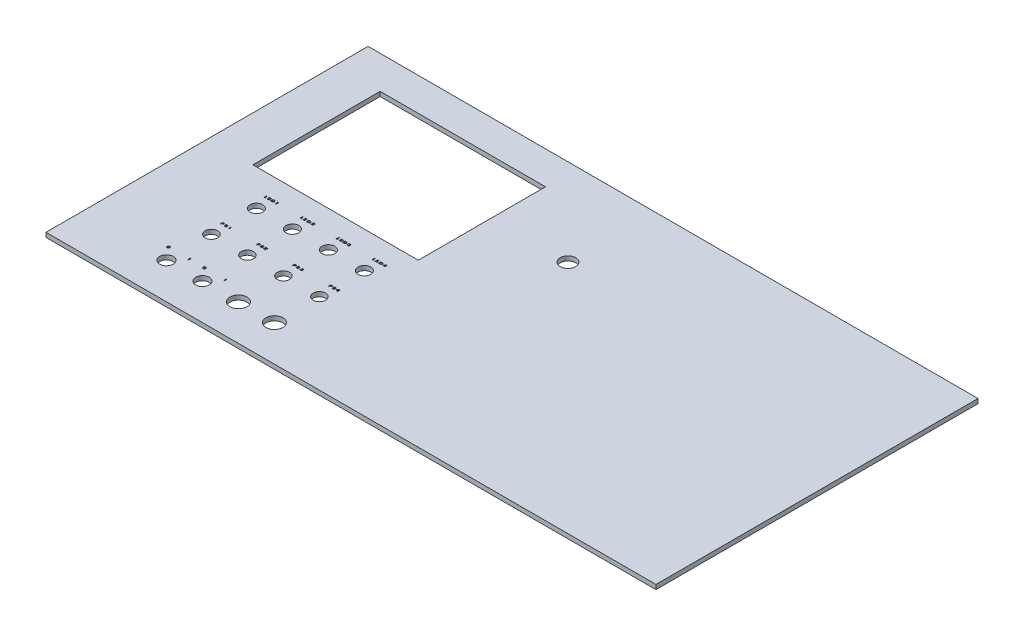
from build123d import *

# Parameters (mm, degrees)
SKETCH1_W           = 861.06
SKETCH1_H           = 454.66
BOSS_EXTRUDE1_DEPTH = 6.35
SKETCH3_W           = 233.426
SKETCH3_H           = 179.578
CUT_EXTRUDE2_DEPTH  = 974.745532313
SKETCH4_R           = 9.017
CUT_EXTRUDE3_DEPTH  = 974.745532313
SKETCH5_R           = 8.763
CUT_EXTRUDE4_DEPTH  = 974.745532313
SKETCH6_R           = 9.525
CUT_EXTRUDE5_DEPTH  = 974.745532313
SKETCH7_R           = 11.938
CUT_EXTRUDE6_DEPTH  = 974.745532313
CUT_EXTRUDE7_DEPTH  = 1.27
SKETCH9_R           = 10.922
CUT_EXTRUDE8_DEPTH  = 974.745532448


with BuildPart() as part:
    # Sketch1 → Boss-Extrude1 (new body)
    with BuildSketch(Plane(origin=(0, 0, 0), x_dir=(1, 0, 0), z_dir=(0, 1, 0))):
        with Locations((430.53, 227.33)):
            Rectangle(SKETCH1_W, SKETCH1_H)
    extrude(amount=BOSS_EXTRUDE1_DEPTH)

    # Sketch3 → Cut-Extrude2 (cut, through all)
    with BuildSketch(Plane(origin=(0, 6.35, 0), x_dir=(1, 0, 0), z_dir=(0, 1, 0))):
        with Locations((180.213, 318.389)):
            Rectangle(SKETCH3_W, SKETCH3_H)
    extrude(amount=-CUT_EXTRUDE2_DEPTH, mode=Mode.SUBTRACT)

    # Sketch4 → Cut-Extrude3 (cut, through all)
    with BuildSketch(Plane(origin=(0, 6.35, 0), x_dir=(1, 0, 0), z_dir=(0, 1, 0))):
        with Locations((119.253, 177.8)):
            Circle(SKETCH4_R)
        with Locations((170.053, 177.8)):
            Circle(SKETCH4_R)
        with Locations((220.853, 177.8)):
            Circle(SKETCH4_R)
        with Locations((271.653, 177.8)):
            Circle(SKETCH4_R)
    extrude(amount=-CUT_EXTRUDE3_DEPTH, mode=Mode.SUBTRACT)

    # Sketch5 → Cut-Extrude4 (cut, through all)
    with BuildSketch(Plane(origin=(0, 6.35, 0), x_dir=(1, 0, 0), z_dir=(0, 1, 0))):
        with Locations((119.253, 114.3)):
            Circle(SKETCH5_R)
        with Locations((170.053, 114.3)):
            Circle(SKETCH5_R)
        with Locations((220.853, 114.3)):
            Circle(SKETCH5_R)
        with Locations((271.653, 114.3)):
            Circle(SKETCH5_R)
    extrude(amount=-CUT_EXTRUDE4_DEPTH, mode=Mode.SUBTRACT)

    # Sketch6 → Cut-Extrude5 (cut, through all)
    with BuildSketch(Plane(origin=(0, 6.35, 0), x_dir=(1, 0, 0), z_dir=(0, 1, 0))):
        with Locations((119.253, 50.8)):
            Circle(SKETCH6_R)
        with Locations((170.053, 50.8)):
            Circle(SKETCH6_R)
    extrude(amount=-CUT_EXTRUDE5_DEPTH, mode=Mode.SUBTRACT)

    # Sketch7 → Cut-Extrude6 (cut, through all)
    with BuildSketch(Plane(origin=(0, 6.35, 0), x_dir=(1, 0, 0), z_dir=(0, 1, 0))):
        with Locations((220.853, 50.8)):
            Circle(SKETCH7_R)
        with Locations((271.653, 50.8)):
            Circle(SKETCH7_R)
    extrude(amount=-CUT_EXTRUDE6_DEPTH, mode=Mode.SUBTRACT)

    # Sketch8 → Cut-Extrude7 (cut)
    # profile 1 of 32: a face of its own
    with BuildSketch(Plane(origin=(0, 6.35, 0), x_dir=(1, 0, 0), z_dir=(0, 1, 0))):
        Polygon((111.073333333, 200.35), (112.060512821, 200.35), (112.060512821, 197.478205128), (113.496410256, 197.478205128), (113.496410256, 196.85), (111.073333333, 196.85), align=None)
    # profile 2 of 32: a face of its own
    with BuildSketch(Plane(origin=(0, 6.35, 0), x_dir=(1, 0, 0), z_dir=(0, 1, 0))):
        Polygon((115.237435897, 200.35), (118.064358974, 200.35), (118.064358974, 199.721794872), (116.224615385, 199.721794872), (116.224615385, 199.048717949), (118.064358974, 199.048717949), (118.064358974, 198.420512821), (116.224615385, 198.420512821), (116.224615385, 197.478205128), (118.064358974, 197.478205128), (118.064358974, 196.85), (115.237435897, 196.85), align=None)
    # profile 3 of 32: a face of its own
    with BuildSketch(Plane(origin=(0, 6.35, 0), x_dir=(1, 0, 0), z_dir=(0, 1, 0))):
        with BuildLine():
            Line((119.984871795, 200.35), (121.159250801, 200.35))
            add(Edge.make_bspline(
                [(121.159250801, 200.35), (121.250872761, 200.349566664), (121.428089202, 200.348728501), (121.684779261, 200.339356608), (121.923265866, 200.324941579), (122.143609118, 200.305028048), (122.345553138, 200.278844706), (122.529200643, 200.245912058), (122.69480494, 200.207850377), (122.844436106, 200.163619384), (122.981172584, 200.110976865), (123.110593172, 200.053263957), (123.233434171, 199.98677023), (123.35089371, 199.914339555), (123.46136754, 199.83297772), (123.565909254, 199.744734859), (123.664220668, 199.648860369), (123.756697648, 199.547082989), (123.840726497, 199.439310157), (123.913312526, 199.325495337), (123.975179635, 199.207595236), (124.026273323, 199.085056078), (124.064425966, 198.95752938), (124.092654922, 198.826057835), (124.109966404, 198.689971279), (124.112030194, 198.597713508), (124.113076923, 198.550921474)],
                knots=[0, 0, 0, 0, 1.693374386, 3.27534779, 4.746813147, 6.108942391, 7.36377171, 8.509323213, 9.556068542, 10.503127147, 11.390414953, 12.262344654, 13.120425789, 13.970247547, 14.810896929, 15.653796188, 16.496905721, 17.347111629, 18.193853914, 19.019452892, 19.838676493, 20.652094301, 21.469242615, 22.295282187, 23.135387591, 24, 24, 24, 24], degree=3))
            add(Edge.make_bspline(
                [(124.113076923, 198.550921474), (124.112689099, 198.51747157), (124.111922541, 198.451355698), (124.10122263, 198.353315593), (124.086259809, 198.257211816), (124.064373284, 198.163047407), (124.036330034, 198.070961008), (124.001674562, 197.980865046), (123.961255173, 197.892632818), (123.914114884, 197.807039547), (123.861243105, 197.724612612), (123.804917187, 197.644449131), (123.742785713, 197.568567217), (123.676041037, 197.496257495), (123.604664453, 197.427329419), (123.527618323, 197.363140887), (123.447316527, 197.300924123), (123.333013705, 197.224910887), (123.183663928, 197.139057638), (122.996011088, 197.052515499), (122.800774826, 196.983406159), (122.629764467, 196.94031936), (122.480896823, 196.913112618), (122.34995964, 196.897194762), (122.200613375, 196.882267486), (122.0322336, 196.870993276), (121.845044827, 196.860745478), (121.638841783, 196.855234506), (121.414012392, 196.850638286), (121.25787828, 196.850218201), (121.176778846, 196.85)],
                knots=[0, 0, 0, 0, 0.733563833, 1.449935774, 2.161446157, 2.866720635, 3.569081052, 4.271890573, 4.983160702, 5.696884989, 6.413843971, 7.130949637, 7.845318354, 8.563834332, 9.289161384, 10.020571367, 10.763113149, 11.516883971, 13.030630894, 14.538050439, 16.044728459, 17.568240811, 18.402058251, 19.363738217, 20.461257557, 21.69501578, 23.066022227, 24.574304971, 26.220619919, 28, 28, 28, 28], degree=3))
            Line((121.176778846, 196.85), (119.984871795, 196.85))
            Line((119.984871795, 196.85), (119.984871795, 200.35))
        make_face()
        with BuildLine():
            Line((120.972051282, 199.721794872), (120.972051282, 197.478205128))
            Line((120.972051282, 197.478205128), (121.434791667, 197.478205128))
            add(Edge.make_bspline(
                [(121.434791667, 197.478205128), (121.489721682, 197.478284601), (121.595874085, 197.478438184), (121.749168528, 197.484942613), (121.890958462, 197.49152841), (122.02064379, 197.504027844), (122.138963848, 197.517814097), (122.245174544, 197.537374932), (122.340421587, 197.557267072), (122.42453716, 197.583259418), (122.50136536, 197.612547542), (122.573282117, 197.646083528), (122.641839754, 197.684060901), (122.706360618, 197.726980099), (122.767515263, 197.774317074), (122.82601723, 197.82517762), (122.880140717, 197.88173881), (122.930216808, 197.942629719), (122.977090455, 198.006788155), (123.016661531, 198.075655754), (123.050931661, 198.147703575), (123.077894004, 198.223739618), (123.09990618, 198.303096942), (123.115195815, 198.386374477), (123.124480139, 198.473116305), (123.125420807, 198.532201437), (123.125897436, 198.562139423)],
                knots=[0, 0, 0, 0, 1.727146602, 3.337715469, 4.824472348, 6.189820039, 7.434109967, 8.568689564, 9.585046685, 10.491724395, 11.33385214, 12.168991953, 12.98489598, 13.796152835, 14.603170893, 15.415525547, 16.231561962, 17.061511701, 17.893638723, 18.726836047, 19.555320219, 20.399209907, 21.260364022, 22.142524227, 23.058831168, 24, 24, 24, 24], degree=3))
            add(Edge.make_bspline(
                [(123.125897436, 198.562139423), (123.124748219, 198.608048107), (123.122499605, 198.697875307), (123.099092404, 198.828457413), (123.062732685, 198.951376369), (123.012281215, 199.06691617), (122.945541971, 199.17340158), (122.864368123, 199.271678191), (122.769640295, 199.363162861), (122.696840482, 199.414911097), (122.659651442, 199.441346154)],
                knots=[0, 0, 0, 0, 1.058576283, 2.071262668, 3.050813316, 4.011969473, 4.971368377, 5.941023039, 6.948192697, 8, 8, 8, 8], degree=3))
            add(Edge.make_bspline(
                [(122.659651442, 199.441346154), (122.622524575, 199.464256018), (122.545361843, 199.5118708), (122.414823132, 199.567143531), (122.269648845, 199.616033949), (122.108027596, 199.654260858), (121.931060452, 199.685172458), (121.738086202, 199.70617777), (121.529407299, 199.71980554), (121.384801751, 199.721116608), (121.309991987, 199.721794872)],
                knots=[0, 0, 0, 0, 0.748851179, 1.556376991, 2.429009872, 3.379850958, 4.407384533, 5.51499452, 6.71441534, 8, 8, 8, 8], degree=3))
            Line((121.309991987, 199.721794872), (120.972051282, 199.721794872))
        make_face(mode=Mode.SUBTRACT)
    # profile 4 of 32: a face of its own
    with BuildSketch(Plane(origin=(0, 6.35, 0), x_dir=(1, 0, 0), z_dir=(0, 1, 0))):
        Polygon((126.609210737, 200.35), (128.097692308, 200.35), (128.097692308, 196.85), (127.110512821, 196.85), (127.110512821, 199.766666667), (126.033589744, 199.766666667), align=None)
    # profile 5 of 32: a face of its own
    with BuildSketch(Plane(origin=(0, 6.35, 0), x_dir=(1, 0, 0), z_dir=(0, 1, 0))):
        Polygon((161.873333333, 200.35), (162.860512821, 200.35), (162.860512821, 197.478205128), (164.296410256, 197.478205128), (164.296410256, 196.85), (161.873333333, 196.85), align=None)
    # profile 6 of 32: a face of its own
    with BuildSketch(Plane(origin=(0, 6.35, 0), x_dir=(1, 0, 0), z_dir=(0, 1, 0))):
        Polygon((166.037435897, 200.35), (168.864358974, 200.35), (168.864358974, 199.721794872), (167.024615385, 199.721794872), (167.024615385, 199.048717949), (168.864358974, 199.048717949), (168.864358974, 198.420512821), (167.024615385, 198.420512821), (167.024615385, 197.478205128), (168.864358974, 197.478205128), (168.864358974, 196.85), (166.037435897, 196.85), align=None)
    # profile 7 of 32: a face of its own
    with BuildSketch(Plane(origin=(0, 6.35, 0), x_dir=(1, 0, 0), z_dir=(0, 1, 0))):
        with BuildLine():
            Line((170.784871795, 200.35), (171.959250801, 200.35))
            add(Edge.make_bspline(
                [(171.959250801, 200.35), (172.050872761, 200.349566664), (172.228089202, 200.348728501), (172.484779261, 200.339356608), (172.723265866, 200.324941579), (172.943609118, 200.305028048), (173.145553138, 200.278844706), (173.329200643, 200.245912058), (173.49480494, 200.207850377), (173.644436106, 200.163619384), (173.781172584, 200.110976865), (173.910593172, 200.053263957), (174.033434171, 199.98677023), (174.15089371, 199.914339555), (174.26136754, 199.83297772), (174.365909254, 199.744734859), (174.464220668, 199.648860369), (174.556697648, 199.547082989), (174.640726497, 199.439310157), (174.713312526, 199.325495337), (174.775179635, 199.207595236), (174.826273323, 199.085056078), (174.864425966, 198.95752938), (174.892654922, 198.826057835), (174.909966404, 198.689971279), (174.912030194, 198.597713508), (174.913076923, 198.550921474)],
                knots=[0, 0, 0, 0, 1.693374386, 3.27534779, 4.746813147, 6.108942391, 7.36377171, 8.509323213, 9.556068542, 10.503127147, 11.390414953, 12.262344654, 13.120425789, 13.970247547, 14.810896929, 15.653796188, 16.496905721, 17.347111629, 18.193853914, 19.019452892, 19.838676493, 20.652094301, 21.469242615, 22.295282187, 23.135387591, 24, 24, 24, 24], degree=3))
            add(Edge.make_bspline(
                [(174.913076923, 198.550921474), (174.912689099, 198.51747157), (174.911922541, 198.451355698), (174.90122263, 198.353315593), (174.886259809, 198.257211816), (174.864373284, 198.163047407), (174.836330034, 198.070961008), (174.801674562, 197.980865046), (174.761255173, 197.892632818), (174.714114884, 197.807039547), (174.661243105, 197.724612612), (174.604917187, 197.644449131), (174.542785713, 197.568567217), (174.476041037, 197.496257495), (174.404664453, 197.427329419), (174.327618323, 197.363140887), (174.247316527, 197.300924123), (174.133013705, 197.224910887), (173.983663928, 197.139057638), (173.796011088, 197.052515499), (173.600774826, 196.983406159), (173.429764467, 196.94031936), (173.280896823, 196.913112618), (173.14995964, 196.897194762), (173.000613375, 196.882267486), (172.8322336, 196.870993276), (172.645044827, 196.860745478), (172.438841783, 196.855234506), (172.214012392, 196.850638286), (172.05787828, 196.850218201), (171.976778846, 196.85)],
                knots=[0, 0, 0, 0, 0.733563833, 1.449935774, 2.161446157, 2.866720635, 3.569081052, 4.271890573, 4.983160702, 5.696884989, 6.413843971, 7.130949637, 7.845318354, 8.563834332, 9.289161384, 10.020571367, 10.763113149, 11.516883971, 13.030630894, 14.538050439, 16.044728459, 17.568240811, 18.402058251, 19.363738217, 20.461257557, 21.69501578, 23.066022227, 24.574304971, 26.220619919, 28, 28, 28, 28], degree=3))
            Line((171.976778846, 196.85), (170.784871795, 196.85))
            Line((170.784871795, 196.85), (170.784871795, 200.35))
        make_face()
        with BuildLine():
            Line((171.772051282, 199.721794872), (171.772051282, 197.478205128))
            Line((171.772051282, 197.478205128), (172.234791667, 197.478205128))
            add(Edge.make_bspline(
                [(172.234791667, 197.478205128), (172.289721682, 197.478284601), (172.395874085, 197.478438184), (172.549168528, 197.484942613), (172.690958462, 197.49152841), (172.82064379, 197.504027844), (172.938963848, 197.517814097), (173.045174544, 197.537374932), (173.140421587, 197.557267072), (173.22453716, 197.583259418), (173.30136536, 197.612547542), (173.373282117, 197.646083528), (173.441839754, 197.684060901), (173.506360618, 197.726980099), (173.567515263, 197.774317074), (173.62601723, 197.82517762), (173.680140717, 197.88173881), (173.730216808, 197.942629719), (173.777090455, 198.006788155), (173.816661531, 198.075655754), (173.850931661, 198.147703575), (173.877894004, 198.223739618), (173.89990618, 198.303096942), (173.915195815, 198.386374477), (173.924480139, 198.473116305), (173.925420807, 198.532201437), (173.925897436, 198.562139423)],
                knots=[0, 0, 0, 0, 1.727146602, 3.337715469, 4.824472348, 6.189820039, 7.434109967, 8.568689564, 9.585046685, 10.491724395, 11.33385214, 12.168991953, 12.98489598, 13.796152835, 14.603170893, 15.415525547, 16.231561962, 17.061511701, 17.893638723, 18.726836047, 19.555320219, 20.399209907, 21.260364022, 22.142524227, 23.058831168, 24, 24, 24, 24], degree=3))
            add(Edge.make_bspline(
                [(173.925897436, 198.562139423), (173.924748219, 198.608048107), (173.922499605, 198.697875307), (173.899092404, 198.828457413), (173.862732685, 198.951376369), (173.812281215, 199.06691617), (173.745541971, 199.17340158), (173.664368123, 199.271678191), (173.569640295, 199.363162861), (173.496840482, 199.414911097), (173.459651442, 199.441346154)],
                knots=[0, 0, 0, 0, 1.058576283, 2.071262668, 3.050813316, 4.011969473, 4.971368377, 5.941023039, 6.948192697, 8, 8, 8, 8], degree=3))
            add(Edge.make_bspline(
                [(173.459651442, 199.441346154), (173.422524575, 199.464256018), (173.345361843, 199.5118708), (173.214823132, 199.567143531), (173.069648845, 199.616033949), (172.908027596, 199.654260858), (172.731060452, 199.685172458), (172.538086202, 199.70617777), (172.329407299, 199.71980554), (172.184801751, 199.721116608), (172.109991987, 199.721794872)],
                knots=[0, 0, 0, 0, 0.748851179, 1.556376991, 2.429009872, 3.379850958, 4.407384533, 5.51499452, 6.71441534, 8, 8, 8, 8], degree=3))
            Line((172.109991987, 199.721794872), (171.772051282, 199.721794872))
        make_face(mode=Mode.SUBTRACT)
    # profile 8 of 32: a face of its own
    with BuildSketch(Plane(origin=(0, 6.35, 0), x_dir=(1, 0, 0), z_dir=(0, 1, 0))):
        with BuildLine():
            Line((177.506666667, 199.183333333), (176.519487179, 199.183333333))
            add(Edge.make_bspline(
                [(176.519487179, 199.183333333), (176.524084963, 199.230921295), (176.53310829, 199.324314512), (176.563708095, 199.459841989), (176.607955047, 199.587640635), (176.666271336, 199.707685779), (176.739611909, 199.819128032), (176.825270889, 199.923660756), (176.925974376, 200.019358401), (177.039476894, 200.106605588), (177.164251313, 200.184536802), (177.297777869, 200.253924216), (177.440569133, 200.310966456), (177.591589342, 200.357981969), (177.750840357, 200.39541761), (177.919002132, 200.420482112), (178.095258455, 200.437501326), (178.215692044, 200.438985564), (178.277199519, 200.43974359)],
                knots=[0, 0, 0, 0, 0.956037611, 1.876260833, 2.772605913, 3.657394591, 4.539509213, 5.436561718, 6.356154809, 7.313152894, 8.296741356, 9.296607539, 10.32056539, 11.369344437, 12.459570599, 13.590682535, 14.76952074, 16, 16, 16, 16], degree=3))
            add(Edge.make_bspline(
                [(178.277199519, 200.43974359), (178.315536038, 200.43935002), (178.391093548, 200.438574333), (178.502667357, 200.432127996), (178.610721604, 200.421627658), (178.715409743, 200.407274176), (178.816294276, 200.387149703), (178.914325453, 200.36447923), (179.008449907, 200.336210242), (179.099369745, 200.304773024), (179.18628885, 200.269113481), (179.268897655, 200.229230347), (179.347009405, 200.18554747), (179.420995266, 200.138599117), (179.490329711, 200.087506068), (179.554977357, 200.03245549), (179.615777544, 199.97446181), (179.670327048, 199.911991642), (179.720945478, 199.848900182), (179.764783318, 199.784284692), (179.800667389, 199.71877098), (179.832671578, 199.654385201), (179.855476563, 199.588500902), (179.87260443, 199.522683426), (179.882628972, 199.456375376), (179.884126573, 199.412164213), (179.884871795, 199.390164263)],
                knots=[0, 0, 0, 0, 1.305773114, 2.57355042, 3.805299843, 5.003166888, 6.170977339, 7.308271283, 8.429147933, 9.516767106, 10.584124427, 11.627340595, 12.639477076, 13.631023648, 14.610222032, 15.570402507, 16.521864285, 17.469220959, 18.392970856, 19.276142198, 20.124358359, 20.936193589, 21.721765795, 22.494076729, 23.250636402, 24, 24, 24, 24], degree=3))
            add(Edge.make_bspline(
                [(179.884871795, 199.390164263), (179.884009028, 199.363476592), (179.882267684, 199.309612197), (179.869546661, 199.228236123), (179.850093429, 199.145337663), (179.821707329, 199.060952798), (179.78493124, 198.975377092), (179.740330437, 198.888221556), (179.688668752, 198.799166009), (179.627579813, 198.708503611), (179.555770126, 198.615248452), (179.472443695, 198.517473451), (179.374300208, 198.41713334), (179.263844776, 198.311498514), (179.139953773, 198.202022793), (179.002740495, 198.088111883), (178.852073942, 197.970708303), (178.746190121, 197.892336603), (178.6915625, 197.851903045)],
                knots=[0, 0, 0, 0, 0.636129666, 1.283916433, 1.959714468, 2.664569988, 3.403576632, 4.178617281, 4.997680171, 5.8569826, 6.783153769, 7.802791294, 8.918059507, 10.128034395, 11.446439279, 12.859109809, 14.379550725, 16, 16, 16, 16], degree=3))
            Line((178.6915625, 197.851903045), (178.123653846, 197.433333333))
            Line((178.123653846, 197.433333333), (179.92974359, 197.433333333))
            Line((179.92974359, 197.433333333), (179.92974359, 196.85))
            Line((179.92974359, 196.85), (176.384871795, 196.85))
            Line((176.384871795, 196.85), (176.384871795, 197.168309295))
            Line((176.384871795, 197.168309295), (177.95328125, 198.271173878))
            add(Edge.make_bspline(
                [(177.95328125, 198.271173878), (177.998722156, 198.303283724), (178.086346514, 198.365201605), (178.210972633, 198.456699666), (178.323694549, 198.543579873), (178.423612995, 198.626608375), (178.513068216, 198.703052884), (178.589917383, 198.775707638), (178.655147911, 198.842983771), (178.708885448, 198.906759295), (178.753663343, 198.967066485), (178.791677808, 199.025466304), (178.824067082, 199.082321115), (178.851078152, 199.13762927), (178.871514052, 199.191928768), (178.886190157, 199.244471177), (178.896214965, 199.295599945), (178.897204551, 199.32935571), (178.897692308, 199.34599359)],
                knots=[0, 0, 0, 0, 1.80896824, 3.488259695, 5.026346342, 6.435066536, 7.71169278, 8.851183385, 9.872242404, 10.756587062, 11.56049936, 12.312883826, 13.020667955, 13.68676569, 14.31195329, 14.903742748, 15.459665749, 16, 16, 16, 16], degree=3))
            add(Edge.make_bspline(
                [(178.897692308, 199.34599359), (178.897216117, 199.362396813), (178.896269732, 199.394996752), (178.886804298, 199.442586549), (178.871957966, 199.488015583), (178.851506152, 199.531318074), (178.824471686, 199.572235427), (178.791455834, 199.610820959), (178.752115824, 199.646590688), (178.708450729, 199.680972083), (178.659593171, 199.711340011), (178.607052363, 199.738249415), (178.5513814, 199.761469146), (178.49179402, 199.779318191), (178.42942939, 199.794575546), (178.363400411, 199.803639803), (178.294170112, 199.810509038), (178.246836874, 199.811189016), (178.222512019, 199.811538462)],
                knots=[0, 0, 0, 0, 0.862927638, 1.71499152, 2.543988277, 3.375265886, 4.22866202, 5.119062327, 6.042203892, 7.024490353, 8.042072477, 9.065887479, 10.130962887, 11.213179919, 12.338622969, 13.508285038, 14.71949171, 16, 16, 16, 16], degree=3))
            add(Edge.make_bspline(
                [(178.222512019, 199.811538462), (178.197956127, 199.810945279), (178.149657352, 199.809778553), (178.078772963, 199.802216687), (178.01110472, 199.788605006), (177.946395649, 199.770732204), (177.884934359, 199.746603973), (177.826746512, 199.717192035), (177.771791822, 199.682430876), (177.719846649, 199.643663076), (177.673118677, 199.599419838), (177.631245736, 199.551494019), (177.595411695, 199.499551424), (177.565702918, 199.443491042), (177.541989706, 199.383714421), (177.52359175, 199.320386854), (177.511623867, 199.25314179), (177.508346069, 199.206983074), (177.506666667, 199.183333333)],
                knots=[0, 0, 0, 0, 1.109013707, 2.181309585, 3.21418384, 4.223217855, 5.209078266, 6.190862516, 7.163069267, 8.14252479, 9.113183485, 10.063370779, 11.011915367, 11.956222732, 12.922452981, 13.911190504, 14.929783829, 16, 16, 16, 16], degree=3))
        make_face()
    # profile 9 of 32: a face of its own
    with BuildSketch(Plane(origin=(0, 6.35, 0), x_dir=(1, 0, 0), z_dir=(0, 1, 0))):
        with BuildLine():
            Line((112.851333333, 136.85), (113.903717147, 136.85))
            add(Edge.make_bspline(
                [(113.903717147, 136.85), (113.972429737, 136.849799194), (114.104732734, 136.849412552), (114.295721552, 136.844572766), (114.471722694, 136.836059616), (114.63309086, 136.825347975), (114.779660954, 136.810512256), (114.911440351, 136.793542874), (115.02827325, 136.772778779), (115.131734234, 136.748039637), (115.225098147, 136.719159078), (115.312634486, 136.688208114), (115.394220384, 136.651055647), (115.472129023, 136.612621866), (115.543554176, 136.56755432), (115.611225443, 136.520470283), (115.673145958, 136.468114808), (115.729931001, 136.412143333), (115.78097438, 136.352914714), (115.825662339, 136.290573515), (115.863818819, 136.225571055), (115.893865626, 136.156871959), (115.917758037, 136.085778964), (115.935747895, 136.011753158), (115.945253503, 135.934585064), (115.94673771, 135.88224106), (115.947487179, 135.855809295)],
                knots=[0, 0, 0, 0, 1.946728274, 3.748337642, 5.412200171, 6.938796113, 8.329630926, 9.585406812, 10.702359772, 11.69003228, 12.596966834, 13.470410824, 14.318179131, 15.135482783, 15.929302113, 16.70826363, 17.469577399, 18.22339663, 18.96528578, 19.681894402, 20.393961265, 21.096513435, 21.802147877, 22.516826711, 23.251052922, 24, 24, 24, 24], degree=3))
            add(Edge.make_bspline(
                [(115.947487179, 135.855809295), (115.946754155, 135.826543934), (115.945309479, 135.768866557), (115.931629341, 135.684395514), (115.909179868, 135.603652048), (115.877181962, 135.526933287), (115.837292073, 135.453453816), (115.787450535, 135.384372848), (115.729153035, 135.318802603), (115.66125241, 135.258427462), (115.587192357, 135.200591995), (115.505673334, 135.148435378), (115.418081836, 135.100378307), (115.324015583, 135.057139368), (115.223552126, 135.017919548), (115.116883157, 134.982856532), (115.00383908, 134.952538894), (114.925816687, 134.936906244), (114.885988782, 134.928926282)],
                knots=[0, 0, 0, 0, 0.913699387, 1.800756288, 2.665261459, 3.526244706, 4.392136167, 5.271437, 6.18154126, 7.12746094, 8.105929228, 9.114471613, 10.147015659, 11.22502329, 12.346296715, 13.51457821, 14.731272665, 16, 16, 16, 16], degree=3))
            add(Edge.make_bspline(
                [(114.885988782, 134.928926282), (114.859617044, 134.924455005), (114.802169096, 134.914714817), (114.708012817, 134.905012814), (114.599323649, 134.895915194), (114.475673353, 134.888157603), (114.337271914, 134.882948942), (114.183951705, 134.878775782), (114.016141743, 134.875809133), (113.899278087, 134.875698534), (113.838512821, 134.875641026)],
                knots=[0, 0, 0, 0, 0.611312755, 1.331678009, 2.162671672, 3.104784941, 4.163461421, 5.328565698, 6.610941828, 8, 8, 8, 8], degree=3))
            Line((113.838512821, 134.875641026), (113.838512821, 133.35))
            Line((113.838512821, 133.35), (112.851333333, 133.35))
            Line((112.851333333, 133.35), (112.851333333, 136.85))
        make_face()
        with BuildLine():
            Line((113.838512821, 135.503846154), (114.147707532, 135.503846154))
            add(Edge.make_bspline(
                [(114.147707532, 135.503846154), (114.17692127, 135.504037047), (114.233014852, 135.504403584), (114.313659737, 135.505611427), (114.38753837, 135.508314372), (114.454367471, 135.512662864), (114.514502825, 135.517248566), (114.567313368, 135.523644671), (114.613482949, 135.530375492), (114.664629787, 135.541275821), (114.720754486, 135.55880603), (114.781056495, 135.585541615), (114.834104022, 135.617510588), (114.879003461, 135.655775116), (114.915116565, 135.699313734), (114.941667302, 135.74772241), (114.957818881, 135.800810714), (114.959467258, 135.837701463), (114.960307692, 135.856510417)],
                knots=[0, 0, 0, 0, 1.422534539, 2.731422333, 3.927179836, 5.021783057, 5.992350141, 6.863266647, 7.611663522, 8.263405706, 9.40797824, 10.467533011, 11.468771286, 12.413029741, 13.326617707, 14.207587563, 15.086128575, 16, 16, 16, 16], degree=3))
            add(Edge.make_bspline(
                [(114.960307692, 135.856510417), (114.959656925, 135.872922306), (114.958387569, 135.904934587), (114.947778892, 135.951355734), (114.92895776, 135.994023367), (114.903766151, 136.033622306), (114.870729604, 136.069116547), (114.830711237, 136.100611525), (114.784321285, 136.130007847), (114.749296209, 136.14471719), (114.731040865, 136.152383814)],
                knots=[0, 0, 0, 0, 0.983386196, 1.918148081, 2.834452621, 3.767322061, 4.7193592, 5.726031039, 6.814789588, 8, 8, 8, 8], degree=3))
            add(Edge.make_bspline(
                [(114.731040865, 136.152383814), (114.715702051, 136.158029651), (114.682691427, 136.170180042), (114.62721336, 136.183790077), (114.563260599, 136.195336854), (114.490270327, 136.205191146), (114.408624913, 136.212568699), (114.317921744, 136.218366682), (114.21829778, 136.220655791), (114.148876155, 136.221404296), (114.112651442, 136.221794872)],
                knots=[0, 0, 0, 0, 0.627014203, 1.349395672, 2.188707916, 3.121226466, 4.175472397, 5.334965939, 6.609365681, 8, 8, 8, 8], degree=3))
            Line((114.112651442, 136.221794872), (113.838512821, 136.221794872))
            Line((113.838512821, 136.221794872), (113.838512821, 135.503846154))
        make_face(mode=Mode.SUBTRACT)
    # profile 10 of 32: a face of its own
    with BuildSketch(Plane(origin=(0, 6.35, 0), x_dir=(1, 0, 0), z_dir=(0, 1, 0))):
        with BuildLine():
            Line((117.868, 133.35), (117.868, 136.85))
            Line((117.868, 136.85), (118.684105769, 136.85))
            add(Edge.make_bspline(
                [(118.684105769, 136.85), (118.741366634, 136.850011414), (118.851693869, 136.850033406), (119.011320622, 136.846114403), (119.158794408, 136.841259869), (119.294662155, 136.835536847), (119.418504443, 136.826052696), (119.530537634, 136.81595042), (119.630690196, 136.803653442), (119.693056603, 136.792744543), (119.722467147, 136.78760016)],
                knots=[0, 0, 0, 0, 1.31948929, 2.542322856, 3.679315054, 4.719870347, 5.675693744, 6.541172342, 7.312050872, 8, 8, 8, 8], degree=3))
            add(Edge.make_bspline(
                [(119.722467147, 136.78760016), (119.760422782, 136.780320021), (119.834906776, 136.766033504), (119.942701613, 136.737713914), (120.044570631, 136.705622142), (120.140469185, 136.669176959), (120.23047093, 136.627801108), (120.314556443, 136.581589506), (120.392682255, 136.531092991), (120.464183528, 136.476465588), (120.528718864, 136.418588102), (120.585082717, 136.357720284), (120.632479545, 136.293837715), (120.672268073, 136.227970123), (120.702656554, 136.158896147), (120.723440753, 136.087164071), (120.737698028, 136.013190102), (120.739090634, 135.962681496), (120.739794872, 135.937139423)],
                knots=[0, 0, 0, 0, 1.288638081, 2.528818454, 3.714528151, 4.849421997, 5.948001761, 7.015476048, 8.046736511, 9.047591826, 10.013384564, 10.934618588, 11.80916513, 12.662011224, 13.496166577, 14.3174033, 15.149115171, 16, 16, 16, 16], degree=3))
            add(Edge.make_bspline(
                [(120.739794872, 135.937139423), (120.738130189, 135.904277953), (120.734824729, 135.839026924), (120.709586142, 135.74346014), (120.666253914, 135.653437517), (120.607154607, 135.567147642), (120.528427736, 135.48540156), (120.429878635, 135.407061411), (120.310546073, 135.331517743), (120.222078969, 135.286446111), (120.175391827, 135.262660256)],
                knots=[0, 0, 0, 0, 0.846570316, 1.680983366, 2.527232041, 3.411263011, 4.365891141, 5.441371359, 6.649723432, 8, 8, 8, 8], degree=3))
            add(Edge.make_bspline(
                [(120.175391827, 135.262660256), (120.214059367, 135.250113987), (120.28931234, 135.225697021), (120.397173049, 135.185040156), (120.497256441, 135.142383523), (120.589030147, 135.096971776), (120.672776028, 135.049115885), (120.748967714, 134.999723506), (120.816414806, 134.946799541), (120.876466371, 134.892180705), (120.928723794, 134.83469276), (120.974857049, 134.775399376), (121.012397147, 134.712342812), (121.044801583, 134.647824752), (121.068159821, 134.579967571), (121.08606753, 134.510174061), (121.096810894, 134.43753856), (121.098110238, 134.388162989), (121.098769231, 134.363120994)],
                knots=[0, 0, 0, 0, 1.404636823, 2.733638992, 3.981780949, 5.162825121, 6.269721482, 7.313539045, 8.297398225, 9.229093884, 10.115148496, 10.979328281, 11.820057026, 12.647176798, 13.469670561, 14.294302631, 15.134914998, 16, 16, 16, 16], degree=3))
            add(Edge.make_bspline(
                [(121.098769231, 134.363120994), (121.098106576, 134.339009411), (121.096787779, 134.291023221), (121.085811089, 134.219869459), (121.06848068, 134.150269792), (121.0433042, 134.082378531), (121.012354309, 134.015631262), (120.971885269, 133.951762949), (120.926758265, 133.888365435), (120.873995439, 133.827776469), (120.815954657, 133.769880389), (120.753704236, 133.715238672), (120.687310856, 133.664585528), (120.617152492, 133.617197544), (120.541979471, 133.574904893), (120.463358893, 133.535601704), (120.380983502, 133.499383386), (120.293281004, 133.467940348), (120.199584706, 133.439455839), (120.097767725, 133.416197326), (119.988258389, 133.394641565), (119.869662072, 133.379416845), (119.7430291, 133.365600325), (119.607809017, 133.357059311), (119.464271896, 133.351235268), (119.365836386, 133.350420056), (119.315115385, 133.35)],
                knots=[0, 0, 0, 0, 0.763234275, 1.518967293, 2.274700312, 3.030976776, 3.808996623, 4.599830996, 5.421511535, 6.271665876, 7.140431499, 8.016324575, 8.892686587, 9.783586145, 10.69518197, 11.621974588, 12.56662274, 13.542952754, 14.570884772, 15.665980933, 16.849012928, 18.104034293, 19.451034968, 20.882727707, 22.393758769, 24, 24, 24, 24], degree=3))
            Line((119.315115385, 133.35), (117.868, 133.35))
        make_face()
        with BuildLine():
            Line((118.855179487, 136.221794872), (118.855179487, 135.458974359))
            Line((118.855179487, 135.458974359), (119.064113782, 135.458974359))
            add(Edge.make_bspline(
                [(119.064113782, 135.458974359), (119.092400988, 135.459162026), (119.1469189, 135.459523715), (119.226000274, 135.464579188), (119.299320254, 135.472600736), (119.367107551, 135.484857896), (119.429396824, 135.498971983), (119.48610754, 135.517443437), (119.537132894, 135.538820042), (119.582580211, 135.563704346), (119.622733823, 135.590889742), (119.657647261, 135.621057466), (119.685998453, 135.654631592), (119.711618186, 135.688660376), (119.729620342, 135.726752048), (119.743159246, 135.766695403), (119.750877984, 135.80924381), (119.752029673, 135.838252127), (119.752615385, 135.853004808)],
                knots=[0, 0, 0, 0, 1.531470513, 2.951601988, 4.289032099, 5.522818593, 6.680046859, 7.744576757, 8.7482429, 9.671368044, 10.545391607, 11.370400094, 12.159694004, 12.921734149, 13.668811109, 14.429168115, 15.201126318, 16, 16, 16, 16], degree=3))
            add(Edge.make_bspline(
                [(119.752615385, 135.853004808), (119.751957424, 135.866811843), (119.750666533, 135.893900678), (119.74404975, 135.93352569), (119.730720327, 135.97053027), (119.713666735, 136.005969004), (119.689520817, 136.038070132), (119.662551477, 136.069595466), (119.628883001, 136.097337707), (119.591054704, 136.123470362), (119.547941582, 136.146517806), (119.499849756, 136.166911485), (119.446427737, 136.184451452), (119.387522985, 136.198251422), (119.323521113, 136.208516655), (119.254496231, 136.216134433), (119.180109534, 136.22125913), (119.128626132, 136.221612131), (119.101974359, 136.221794872)],
                knots=[0, 0, 0, 0, 0.794923146, 1.559606406, 2.299305798, 3.050759689, 3.811771406, 4.602135162, 5.431762038, 6.311701388, 7.243988896, 8.237728068, 9.313205348, 10.473932854, 11.713699693, 13.039329106, 14.467328779, 16, 16, 16, 16], degree=3))
            Line((119.101974359, 136.221794872), (118.855179487, 136.221794872))
        make_face(mode=Mode.SUBTRACT)
        with BuildLine():
            Line((118.855179487, 134.875641026), (118.855179487, 133.978205128))
            Line((118.855179487, 133.978205128), (119.096365385, 133.978205128))
            add(Edge.make_bspline(
                [(119.096365385, 133.978205128), (119.144279294, 133.978400965), (119.235928568, 133.978775559), (119.367346569, 133.98358937), (119.486577272, 133.992053168), (119.593779453, 134.002773262), (119.688864459, 134.017251832), (119.77153967, 134.035292668), (119.842404961, 134.055817281), (119.90197048, 134.080514283), (119.951512556, 134.109199995), (119.994560308, 134.139368173), (120.030743234, 134.173310875), (120.060246659, 134.210417316), (120.083364497, 134.250554556), (120.099373832, 134.293691216), (120.109545259, 134.339751106), (120.110899299, 134.37148081), (120.111589744, 134.387660256)],
                knots=[0, 0, 0, 0, 1.900664809, 3.635573708, 5.215581466, 6.641794037, 7.908444062, 9.028674666, 9.996605344, 10.831724618, 11.579184148, 12.263551699, 12.912859337, 13.539807459, 14.137775083, 14.742176496, 15.358617136, 16, 16, 16, 16], degree=3))
            add(Edge.make_bspline(
                [(120.111589744, 134.387660256), (120.11108876, 134.406202214), (120.110107239, 134.442529425), (120.097245018, 134.495079623), (120.078427663, 134.544842574), (120.051490411, 134.591512285), (120.016428364, 134.63468135), (119.973889676, 134.674820961), (119.923629097, 134.711965636), (119.865741555, 134.746461887), (119.798988798, 134.777706967), (119.722257167, 134.803837905), (119.635746594, 134.826160025), (119.539162923, 134.843917979), (119.43255093, 134.858964396), (119.315466047, 134.867908566), (119.188524163, 134.874633875), (119.100582653, 134.875297199), (119.054999199, 134.875641026)],
                knots=[0, 0, 0, 0, 0.690419058, 1.352661837, 2.007046633, 2.671296647, 3.353736276, 4.075560012, 4.848333838, 5.681504583, 6.586748777, 7.593567271, 8.702088903, 9.918335251, 11.256676684, 12.718365048, 14.299002886, 16, 16, 16, 16], degree=3))
            Line((119.054999199, 134.875641026), (118.855179487, 134.875641026))
        make_face(mode=Mode.SUBTRACT)
    # profile 11 of 32: a face of its own
    with BuildSketch(Plane(origin=(0, 6.35, 0), x_dir=(1, 0, 0), z_dir=(0, 1, 0))):
        Polygon((123.594903045, 136.85), (125.083384615, 136.85), (125.083384615, 133.35), (124.096205128, 133.35), (124.096205128, 136.266666667), (123.019282051, 136.266666667), align=None)
    # profile 12 of 32: a face of its own
    with BuildSketch(Plane(origin=(0, 6.35, 0), x_dir=(1, 0, 0), z_dir=(0, 1, 0))):
        Polygon((212.673333333, 200.35), (213.660512821, 200.35), (213.660512821, 197.478205128), (215.096410256, 197.478205128), (215.096410256, 196.85), (212.673333333, 196.85), align=None)
    # profile 13 of 32: a face of its own
    with BuildSketch(Plane(origin=(0, 6.35, 0), x_dir=(1, 0, 0), z_dir=(0, 1, 0))):
        Polygon((216.837435897, 200.35), (219.664358974, 200.35), (219.664358974, 199.721794872), (217.824615385, 199.721794872), (217.824615385, 199.048717949), (219.664358974, 199.048717949), (219.664358974, 198.420512821), (217.824615385, 198.420512821), (217.824615385, 197.478205128), (219.664358974, 197.478205128), (219.664358974, 196.85), (216.837435897, 196.85), align=None)
    # profile 14 of 32: a face of its own
    with BuildSketch(Plane(origin=(0, 6.35, 0), x_dir=(1, 0, 0), z_dir=(0, 1, 0))):
        with BuildLine():
            Line((221.584871795, 200.35), (222.759250801, 200.35))
            add(Edge.make_bspline(
                [(222.759250801, 200.35), (222.850872761, 200.349566664), (223.028089202, 200.348728501), (223.284779261, 200.339356608), (223.523265866, 200.324941579), (223.743609118, 200.305028048), (223.945553138, 200.278844706), (224.129200643, 200.245912058), (224.29480494, 200.207850377), (224.444436106, 200.163619384), (224.581172584, 200.110976865), (224.710593172, 200.053263957), (224.833434171, 199.98677023), (224.95089371, 199.914339555), (225.06136754, 199.83297772), (225.165909254, 199.744734859), (225.264220668, 199.648860369), (225.356697648, 199.547082989), (225.440726497, 199.439310157), (225.513312526, 199.325495337), (225.575179635, 199.207595236), (225.626273323, 199.085056078), (225.664425966, 198.95752938), (225.692654922, 198.826057835), (225.709966404, 198.689971279), (225.712030194, 198.597713508), (225.713076923, 198.550921474)],
                knots=[0, 0, 0, 0, 1.693374386, 3.27534779, 4.746813147, 6.108942391, 7.36377171, 8.509323213, 9.556068542, 10.503127147, 11.390414953, 12.262344654, 13.120425789, 13.970247547, 14.810896929, 15.653796188, 16.496905721, 17.347111629, 18.193853914, 19.019452892, 19.838676493, 20.652094301, 21.469242615, 22.295282187, 23.135387591, 24, 24, 24, 24], degree=3))
            add(Edge.make_bspline(
                [(225.713076923, 198.550921474), (225.712689099, 198.51747157), (225.711922541, 198.451355698), (225.70122263, 198.353315593), (225.686259809, 198.257211816), (225.664373284, 198.163047407), (225.636330034, 198.070961008), (225.601674562, 197.980865046), (225.561255173, 197.892632818), (225.514114884, 197.807039547), (225.461243105, 197.724612612), (225.404917187, 197.644449131), (225.342785713, 197.568567217), (225.276041037, 197.496257495), (225.204664453, 197.427329419), (225.127618323, 197.363140887), (225.047316527, 197.300924123), (224.933013705, 197.224910887), (224.783663928, 197.139057638), (224.596011088, 197.052515499), (224.400774826, 196.983406159), (224.229764467, 196.94031936), (224.080896823, 196.913112618), (223.94995964, 196.897194762), (223.800613375, 196.882267486), (223.6322336, 196.870993276), (223.445044827, 196.860745478), (223.238841783, 196.855234506), (223.014012392, 196.850638286), (222.85787828, 196.850218201), (222.776778846, 196.85)],
                knots=[0, 0, 0, 0, 0.733563833, 1.449935774, 2.161446157, 2.866720635, 3.569081052, 4.271890573, 4.983160702, 5.696884989, 6.413843971, 7.130949637, 7.845318354, 8.563834332, 9.289161384, 10.020571367, 10.763113149, 11.516883971, 13.030630894, 14.538050439, 16.044728459, 17.568240811, 18.402058251, 19.363738217, 20.461257557, 21.69501578, 23.066022227, 24.574304971, 26.220619919, 28, 28, 28, 28], degree=3))
            Line((222.776778846, 196.85), (221.584871795, 196.85))
            Line((221.584871795, 196.85), (221.584871795, 200.35))
        make_face()
        with BuildLine():
            Line((222.572051282, 199.721794872), (222.572051282, 197.478205128))
            Line((222.572051282, 197.478205128), (223.034791667, 197.478205128))
            add(Edge.make_bspline(
                [(223.034791667, 197.478205128), (223.089721682, 197.478284601), (223.195874085, 197.478438184), (223.349168528, 197.484942613), (223.490958462, 197.49152841), (223.62064379, 197.504027844), (223.738963848, 197.517814097), (223.845174544, 197.537374932), (223.940421587, 197.557267072), (224.02453716, 197.583259418), (224.10136536, 197.612547542), (224.173282117, 197.646083528), (224.241839754, 197.684060901), (224.306360618, 197.726980099), (224.367515263, 197.774317074), (224.42601723, 197.82517762), (224.480140717, 197.88173881), (224.530216808, 197.942629719), (224.577090455, 198.006788155), (224.616661531, 198.075655754), (224.650931661, 198.147703575), (224.677894004, 198.223739618), (224.69990618, 198.303096942), (224.715195815, 198.386374477), (224.724480139, 198.473116305), (224.725420807, 198.532201437), (224.725897436, 198.562139423)],
                knots=[0, 0, 0, 0, 1.727146602, 3.337715469, 4.824472348, 6.189820039, 7.434109967, 8.568689564, 9.585046685, 10.491724395, 11.33385214, 12.168991953, 12.98489598, 13.796152835, 14.603170893, 15.415525547, 16.231561962, 17.061511701, 17.893638723, 18.726836047, 19.555320219, 20.399209907, 21.260364022, 22.142524227, 23.058831168, 24, 24, 24, 24], degree=3))
            add(Edge.make_bspline(
                [(224.725897436, 198.562139423), (224.724748219, 198.608048107), (224.722499605, 198.697875307), (224.699092404, 198.828457413), (224.662732685, 198.951376369), (224.612281215, 199.06691617), (224.545541971, 199.17340158), (224.464368123, 199.271678191), (224.369640295, 199.363162861), (224.296840482, 199.414911097), (224.259651442, 199.441346154)],
                knots=[0, 0, 0, 0, 1.058576283, 2.071262668, 3.050813316, 4.011969473, 4.971368377, 5.941023039, 6.948192697, 8, 8, 8, 8], degree=3))
            add(Edge.make_bspline(
                [(224.259651442, 199.441346154), (224.222524575, 199.464256018), (224.145361843, 199.5118708), (224.014823132, 199.567143531), (223.869648845, 199.616033949), (223.708027596, 199.654260858), (223.531060452, 199.685172458), (223.338086202, 199.70617777), (223.129407299, 199.71980554), (222.984801751, 199.721116608), (222.909991987, 199.721794872)],
                knots=[0, 0, 0, 0, 0.748851179, 1.556376991, 2.429009872, 3.379850958, 4.407384533, 5.51499452, 6.71441534, 8, 8, 8, 8], degree=3))
            Line((222.909991987, 199.721794872), (222.572051282, 199.721794872))
        make_face(mode=Mode.SUBTRACT)
    # profile 15 of 32: a face of its own
    with BuildSketch(Plane(origin=(0, 6.35, 0), x_dir=(1, 0, 0), z_dir=(0, 1, 0))):
        with BuildLine():
            Line((228.486153846, 199.497435897), (227.498974359, 199.497435897))
            add(Edge.make_bspline(
                [(227.498974359, 199.497435897), (227.506106262, 199.528907759), (227.520184152, 199.591031065), (227.55122129, 199.680753872), (227.591409092, 199.765276007), (227.640330478, 199.844786698), (227.696445904, 199.920282188), (227.761482372, 199.990800128), (227.83520328, 200.056109074), (227.889367266, 200.094797605), (227.916842949, 200.114423077)],
                knots=[0, 0, 0, 0, 1.011192537, 1.996024987, 2.969452056, 3.939591863, 4.918518874, 5.914167876, 6.941923119, 8, 8, 8, 8], degree=3))
            add(Edge.make_bspline(
                [(227.916842949, 200.114423077), (227.957511271, 200.140696963), (228.039295249, 200.193533737), (228.171550575, 200.258792567), (228.31058742, 200.315362457), (228.45781528, 200.360578213), (228.612166449, 200.39650812), (228.774374252, 200.421300152), (228.9441316, 200.437272753), (229.060101495, 200.438908875), (229.119266827, 200.43974359)],
                knots=[0, 0, 0, 0, 0.918315468, 1.846731985, 2.794020963, 3.764924249, 4.766699646, 5.799376952, 6.877289709, 8, 8, 8, 8], degree=3))
            add(Edge.make_bspline(
                [(229.119266827, 200.43974359), (229.172107148, 200.438948408), (229.275606924, 200.437390862), (229.427646148, 200.424807369), (229.572922799, 200.402722945), (229.712318531, 200.373912062), (229.844730962, 200.334974075), (229.971131558, 200.288961837), (230.090449654, 200.233470029), (230.201799515, 200.169984188), (230.303624655, 200.101455243), (230.393092878, 200.028714064), (230.469053052, 199.952550594), (230.531666967, 199.87313429), (230.579753598, 199.789626608), (230.614727169, 199.703408844), (230.635889953, 199.613666881), (230.638622692, 199.552701757), (230.64, 199.52197516)],
                knots=[0, 0, 0, 0, 1.302193733, 2.550642341, 3.756235542, 4.92206908, 6.05584597, 7.154717592, 8.234462641, 9.294673561, 10.310718749, 11.256200732, 12.131874466, 12.956826606, 13.741271981, 14.498538674, 15.243259218, 16, 16, 16, 16], degree=3))
            add(Edge.make_bspline(
                [(230.64, 199.52197516), (230.639603811, 199.502758818), (230.638815688, 199.46453252), (230.628068815, 199.408266471), (230.613203741, 199.352919967), (230.58985125, 199.29959463), (230.562203796, 199.246447134), (230.526522008, 199.195628839), (230.485837944, 199.145167842), (230.437754586, 199.097314306), (230.384809587, 199.050144757), (230.325400072, 199.006071575), (230.260754366, 198.9639724), (230.190312559, 198.92388466), (230.114189059, 198.886299386), (230.032221901, 198.851131177), (229.944695784, 198.818212835), (229.883810863, 198.798628273), (229.852640224, 198.788601763)],
                knots=[0, 0, 0, 0, 0.800119258, 1.591645101, 2.381489145, 3.185161874, 4.013568761, 4.875907551, 5.769405653, 6.713557645, 7.700982948, 8.724309104, 9.794769094, 10.916571392, 12.102098837, 13.333180292, 14.634695228, 16, 16, 16, 16], degree=3))
            add(Edge.make_bspline(
                [(229.852640224, 198.788601763), (229.891311453, 198.780406954), (229.967050506, 198.764357114), (230.076234496, 198.73319714), (230.179194414, 198.698395244), (230.275326901, 198.658278977), (230.365325258, 198.614161319), (230.448902972, 198.565930563), (230.525956569, 198.513143333), (230.595900906, 198.455695428), (230.658787381, 198.395018928), (230.71422152, 198.331963392), (230.759945865, 198.265283931), (230.798260417, 198.196459663), (230.82790933, 198.124449989), (230.848956204, 198.049645103), (230.861980552, 197.972250183), (230.863562186, 197.919728417), (230.864358974, 197.893269231)],
                knots=[0, 0, 0, 0, 1.293728546, 2.533815881, 3.714517382, 4.849775558, 5.941265959, 6.993686276, 8.005962803, 8.995371638, 9.953064708, 10.864246569, 11.738613893, 12.594681115, 13.438628371, 14.281465168, 15.134244028, 16, 16, 16, 16], degree=3))
            add(Edge.make_bspline(
                [(230.864358974, 197.893269231), (230.862643664, 197.854360954), (230.859242525, 197.777213132), (230.834939011, 197.663804973), (230.793522638, 197.555738415), (230.736766345, 197.451945744), (230.662751222, 197.353482108), (230.573118398, 197.259444443), (230.467468012, 197.169910246), (230.347062501, 197.086307026), (230.214562511, 197.009363764), (230.071453114, 196.942887175), (229.919840147, 196.886053087), (229.759262434, 196.839715104), (229.589973672, 196.804389491), (229.412059389, 196.778428876), (229.225185455, 196.762778027), (229.097562599, 196.761109357), (229.032327724, 196.76025641)],
                knots=[0, 0, 0, 0, 0.786504673, 1.559491364, 2.332723583, 3.119455373, 3.943617157, 4.816072229, 5.741262021, 6.738922434, 7.776414877, 8.835571786, 9.925722684, 11.047404926, 12.211507812, 13.419814664, 14.681129134, 16, 16, 16, 16], degree=3))
            add(Edge.make_bspline(
                [(229.032327724, 196.76025641), (228.970598629, 196.761153193), (228.849995768, 196.762905278), (228.673674476, 196.777885078), (228.506204967, 196.802205755), (228.347281384, 196.836371256), (228.196956559, 196.880759406), (228.054658378, 196.933522667), (227.92171592, 196.997614903), (227.798402151, 197.071190132), (227.68562011, 197.152407166), (227.58597258, 197.242003261), (227.499703083, 197.338505876), (227.426881611, 197.44223636), (227.3675798, 197.553127646), (227.321608329, 197.67117614), (227.289761206, 197.796535466), (227.27971076, 197.883057919), (227.274615385, 197.926923077)],
                knots=[0, 0, 0, 0, 1.271670815, 2.484519433, 3.642873036, 4.756402422, 5.830590107, 6.869835019, 7.879911766, 8.866754574, 9.825096716, 10.73885163, 11.622196025, 12.486501877, 13.343899043, 14.206808774, 15.090887824, 16, 16, 16, 16], degree=3))
            Line((227.274615385, 197.926923077), (228.261794872, 197.926923077))
            add(Edge.make_bspline(
                [(228.261794872, 197.926923077), (228.267442982, 197.904821664), (228.278533881, 197.861422281), (228.302186428, 197.799712781), (228.329079434, 197.741811445), (228.361995777, 197.688771249), (228.3988475, 197.639517467), (228.441164947, 197.595253775), (228.488179158, 197.555685725), (228.539078002, 197.519774432), (228.595167171, 197.489184293), (228.654247174, 197.461692126), (228.717565012, 197.439447265), (228.783688572, 197.420266557), (228.853918706, 197.406612439), (228.92713221, 197.396038072), (229.004168405, 197.389592212), (229.056620926, 197.388844723), (229.083509615, 197.388461538)],
                knots=[0, 0, 0, 0, 1.020269922, 2.003450472, 2.953343047, 3.87374535, 4.792243288, 5.70236278, 6.607841081, 7.539411644, 8.485379026, 9.463705711, 10.453099855, 11.486266885, 12.542842387, 13.652414222, 14.796559208, 16, 16, 16, 16], degree=3))
            add(Edge.make_bspline(
                [(229.083509615, 197.388461538), (229.111569553, 197.388794361), (229.166380434, 197.38944448), (229.246725575, 197.396599785), (229.323273726, 197.40853907), (229.396312031, 197.424741148), (229.466063993, 197.444490504), (229.531394419, 197.470983519), (229.59331439, 197.501086931), (229.651197634, 197.535034894), (229.70378387, 197.57281433), (229.749946932, 197.613090417), (229.789295314, 197.655829276), (229.821636698, 197.700379029), (229.846635595, 197.747361488), (229.864280538, 197.796210484), (229.875230263, 197.847211596), (229.876525043, 197.88199706), (229.877179487, 197.899579327)],
                knots=[0, 0, 0, 0, 1.292303191, 2.524320556, 3.711982348, 4.858682173, 5.969285892, 7.046837327, 8.101284236, 9.138944899, 10.133896275, 11.07982006, 11.956095092, 12.804617312, 13.608890345, 14.398987814, 15.190770475, 16, 16, 16, 16], degree=3))
            add(Edge.make_bspline(
                [(229.877179487, 197.899579327), (229.876214403, 197.918826859), (229.874279402, 197.957418302), (229.859224932, 198.0138536), (229.83358675, 198.067283646), (229.800022986, 198.11927542), (229.754469511, 198.167232131), (229.701448899, 198.215057738), (229.636423536, 198.257515721), (229.564093922, 198.300149865), (229.481445463, 198.337538088), (229.390473253, 198.371404557), (229.290322585, 198.398742995), (229.182130998, 198.423034388), (229.064942295, 198.440725613), (228.939285521, 198.453660092), (228.805307424, 198.46331316), (228.713101764, 198.464680704), (228.665641026, 198.465384615)],
                knots=[0, 0, 0, 0, 0.634201891, 1.271579482, 1.909376202, 2.582639013, 3.302658279, 4.083416331, 4.931967173, 5.857217787, 6.850234219, 7.91813977, 9.054998114, 10.270322884, 11.572752039, 12.959900371, 14.435178774, 16, 16, 16, 16], degree=3))
            Line((228.665641026, 198.465384615), (228.665641026, 199.048717949))
            add(Edge.make_bspline(
                [(228.665641026, 199.048717949), (228.69719451, 199.050529755), (228.75822124, 199.054033919), (228.846617968, 199.060053374), (228.928847942, 199.068064088), (229.004894264, 199.076054975), (229.074809391, 199.085915462), (229.138140772, 199.097096957), (229.195526946, 199.108864903), (229.262185973, 199.126137907), (229.336678544, 199.151754868), (229.417118789, 199.186958019), (229.486699725, 199.228061348), (229.545982277, 199.273108305), (229.593068115, 199.322343762), (229.627142462, 199.374011881), (229.64928974, 199.427236957), (229.651663149, 199.464056586), (229.652820513, 199.482011218)],
                knots=[0, 0, 0, 0, 1.302599686, 2.519322389, 3.651234818, 4.707464898, 5.670519333, 6.560475526, 7.357664485, 8.084225552, 9.397041306, 10.599960696, 11.696823957, 12.7198573, 13.660148647, 14.488331706, 15.262853851, 16, 16, 16, 16], degree=3))
            add(Edge.make_bspline(
                [(229.652820513, 199.482011218), (229.651153864, 199.504977598), (229.647825533, 199.550841917), (229.617626495, 199.615581977), (229.568202465, 199.671955705), (229.502343146, 199.721214271), (229.422027788, 199.762128117), (229.328692063, 199.791338867), (229.224159627, 199.80885153), (229.150656014, 199.810616428), (229.112255609, 199.811538462)],
                knots=[0, 0, 0, 0, 0.785180253, 1.568020661, 2.399079577, 3.337794402, 4.374769174, 5.478466261, 6.682678148, 8, 8, 8, 8], degree=3))
            add(Edge.make_bspline(
                [(229.112255609, 199.811538462), (229.077371251, 199.810441156), (229.008856563, 199.80828599), (228.9085512, 199.791873749), (228.813146305, 199.764517252), (228.724460895, 199.726350897), (228.644775734, 199.680048988), (228.577000481, 199.626663741), (228.522797567, 199.56606154), (228.498177014, 199.51995265), (228.486153846, 199.497435897)],
                knots=[0, 0, 0, 0, 1.137079078, 2.233282234, 3.304108179, 4.365757042, 5.373412676, 6.300508977, 7.17007285, 8, 8, 8, 8], degree=3))
        make_face()
    # profile 16 of 32: a face of its own
    with BuildSketch(Plane(origin=(0, 6.35, 0), x_dir=(1, 0, 0), z_dir=(0, 1, 0))):
        Polygon((263.473333333, 200.35), (264.460512821, 200.35), (264.460512821, 197.478205128), (265.896410256, 197.478205128), (265.896410256, 196.85), (263.473333333, 196.85), align=None)
    # profile 17 of 32: a face of its own
    with BuildSketch(Plane(origin=(0, 6.35, 0), x_dir=(1, 0, 0), z_dir=(0, 1, 0))):
        Polygon((267.637435897, 200.35), (270.464358974, 200.35), (270.464358974, 199.721794872), (268.624615385, 199.721794872), (268.624615385, 199.048717949), (270.464358974, 199.048717949), (270.464358974, 198.420512821), (268.624615385, 198.420512821), (268.624615385, 197.478205128), (270.464358974, 197.478205128), (270.464358974, 196.85), (267.637435897, 196.85), align=None)
    # profile 18 of 32: a face of its own
    with BuildSketch(Plane(origin=(0, 6.35, 0), x_dir=(1, 0, 0), z_dir=(0, 1, 0))):
        with BuildLine():
            Line((272.384871795, 200.35), (273.559250801, 200.35))
            add(Edge.make_bspline(
                [(273.559250801, 200.35), (273.650872761, 200.349566664), (273.828089202, 200.348728501), (274.084779261, 200.339356608), (274.323265866, 200.324941579), (274.543609118, 200.305028048), (274.745553138, 200.278844706), (274.929200643, 200.245912058), (275.09480494, 200.207850377), (275.244436106, 200.163619384), (275.381172584, 200.110976865), (275.510593172, 200.053263957), (275.633434171, 199.98677023), (275.75089371, 199.914339555), (275.86136754, 199.83297772), (275.965909254, 199.744734859), (276.064220668, 199.648860369), (276.156697648, 199.547082989), (276.240726497, 199.439310157), (276.313312526, 199.325495337), (276.375179635, 199.207595236), (276.426273323, 199.085056078), (276.464425966, 198.95752938), (276.492654922, 198.826057835), (276.509966404, 198.689971279), (276.512030194, 198.597713508), (276.513076923, 198.550921474)],
                knots=[0, 0, 0, 0, 1.693374386, 3.27534779, 4.746813147, 6.108942391, 7.36377171, 8.509323213, 9.556068542, 10.503127147, 11.390414953, 12.262344654, 13.120425789, 13.970247547, 14.810896929, 15.653796188, 16.496905721, 17.347111629, 18.193853914, 19.019452892, 19.838676493, 20.652094301, 21.469242615, 22.295282187, 23.135387591, 24, 24, 24, 24], degree=3))
            add(Edge.make_bspline(
                [(276.513076923, 198.550921474), (276.512689099, 198.51747157), (276.511922541, 198.451355698), (276.50122263, 198.353315593), (276.486259809, 198.257211816), (276.464373284, 198.163047407), (276.436330034, 198.070961008), (276.401674562, 197.980865046), (276.361255173, 197.892632818), (276.314114884, 197.807039547), (276.261243105, 197.724612612), (276.204917187, 197.644449131), (276.142785713, 197.568567217), (276.076041037, 197.496257495), (276.004664453, 197.427329419), (275.927618323, 197.363140887), (275.847316527, 197.300924123), (275.733013705, 197.224910887), (275.583663928, 197.139057638), (275.396011088, 197.052515499), (275.200774826, 196.983406159), (275.029764467, 196.94031936), (274.880896823, 196.913112618), (274.74995964, 196.897194762), (274.600613375, 196.882267486), (274.4322336, 196.870993276), (274.245044827, 196.860745478), (274.038841783, 196.855234506), (273.814012392, 196.850638286), (273.65787828, 196.850218201), (273.576778846, 196.85)],
                knots=[0, 0, 0, 0, 0.733563833, 1.449935774, 2.161446157, 2.866720635, 3.569081052, 4.271890573, 4.983160702, 5.696884989, 6.413843971, 7.130949637, 7.845318354, 8.563834332, 9.289161384, 10.020571367, 10.763113149, 11.516883971, 13.030630894, 14.538050439, 16.044728459, 17.568240811, 18.402058251, 19.363738217, 20.461257557, 21.69501578, 23.066022227, 24.574304971, 26.220619919, 28, 28, 28, 28], degree=3))
            Line((273.576778846, 196.85), (272.384871795, 196.85))
            Line((272.384871795, 196.85), (272.384871795, 200.35))
        make_face()
        with BuildLine():
            Line((273.372051282, 199.721794872), (273.372051282, 197.478205128))
            Line((273.372051282, 197.478205128), (273.834791667, 197.478205128))
            add(Edge.make_bspline(
                [(273.834791667, 197.478205128), (273.889721682, 197.478284601), (273.995874085, 197.478438184), (274.149168528, 197.484942613), (274.290958462, 197.49152841), (274.42064379, 197.504027844), (274.538963848, 197.517814097), (274.645174544, 197.537374932), (274.740421587, 197.557267072), (274.82453716, 197.583259418), (274.90136536, 197.612547542), (274.973282117, 197.646083528), (275.041839754, 197.684060901), (275.106360618, 197.726980099), (275.167515263, 197.774317074), (275.22601723, 197.82517762), (275.280140717, 197.88173881), (275.330216808, 197.942629719), (275.377090455, 198.006788155), (275.416661531, 198.075655754), (275.450931661, 198.147703575), (275.477894004, 198.223739618), (275.49990618, 198.303096942), (275.515195815, 198.386374477), (275.524480139, 198.473116305), (275.525420807, 198.532201437), (275.525897436, 198.562139423)],
                knots=[0, 0, 0, 0, 1.727146602, 3.337715469, 4.824472348, 6.189820039, 7.434109967, 8.568689564, 9.585046685, 10.491724395, 11.33385214, 12.168991953, 12.98489598, 13.796152835, 14.603170893, 15.415525547, 16.231561962, 17.061511701, 17.893638723, 18.726836047, 19.555320219, 20.399209907, 21.260364022, 22.142524227, 23.058831168, 24, 24, 24, 24], degree=3))
            add(Edge.make_bspline(
                [(275.525897436, 198.562139423), (275.524748219, 198.608048107), (275.522499605, 198.697875307), (275.499092404, 198.828457413), (275.462732685, 198.951376369), (275.412281215, 199.06691617), (275.345541971, 199.17340158), (275.264368123, 199.271678191), (275.169640295, 199.363162861), (275.096840482, 199.414911097), (275.059651442, 199.441346154)],
                knots=[0, 0, 0, 0, 1.058576283, 2.071262668, 3.050813316, 4.011969473, 4.971368377, 5.941023039, 6.948192697, 8, 8, 8, 8], degree=3))
            add(Edge.make_bspline(
                [(275.059651442, 199.441346154), (275.022524575, 199.464256018), (274.945361843, 199.5118708), (274.814823132, 199.567143531), (274.669648845, 199.616033949), (274.508027596, 199.654260858), (274.331060452, 199.685172458), (274.138086202, 199.70617777), (273.929407299, 199.71980554), (273.784801751, 199.721116608), (273.709991987, 199.721794872)],
                knots=[0, 0, 0, 0, 0.748851179, 1.556376991, 2.429009872, 3.379850958, 4.407384533, 5.51499452, 6.71441534, 8, 8, 8, 8], degree=3))
            Line((273.709991987, 199.721794872), (273.372051282, 199.721794872))
        make_face(mode=Mode.SUBTRACT)
    # profile 19 of 32: a face of its own
    with BuildSketch(Plane(origin=(0, 6.35, 0), x_dir=(1, 0, 0), z_dir=(0, 1, 0))):
        Polygon((280.181486378, 200.43974359), (281.215641026, 200.43974359), (281.215641026, 198.151282051), (281.664358974, 198.151282051), (281.664358974, 197.567948718), (281.215641026, 197.567948718), (281.215641026, 196.85), (280.228461538, 196.85), (280.228461538, 197.567948718), (277.984871795, 197.567948718), (277.984871795, 198.212279647), align=None)
        Polygon((280.228461538, 198.151282051), (280.228461538, 199.342487981), (279.054082532, 198.151282051), align=None, mode=Mode.SUBTRACT)
    # profile 20 of 32: a face of its own
    with BuildSketch(Plane(origin=(0, 6.35, 0), x_dir=(1, 0, 0), z_dir=(0, 1, 0))):
        with BuildLine():
            Line((163.655400535, 136.85), (164.707784349, 136.85))
            add(Edge.make_bspline(
                [(164.707784349, 136.85), (164.776496939, 136.849799194), (164.908799936, 136.849412552), (165.099788754, 136.844572766), (165.275789895, 136.836059616), (165.437158062, 136.825347975), (165.583728156, 136.810512256), (165.715507553, 136.793542874), (165.832340452, 136.772778779), (165.935801436, 136.748039637), (166.029165349, 136.719159078), (166.116701688, 136.688208114), (166.198287586, 136.651055647), (166.276196225, 136.612621866), (166.347621378, 136.56755432), (166.415292645, 136.520470283), (166.47721316, 136.468114808), (166.533998203, 136.412143333), (166.585041582, 136.352914714), (166.629729541, 136.290573515), (166.667886021, 136.225571055), (166.697932828, 136.156871959), (166.721825239, 136.085778964), (166.739815097, 136.011753158), (166.749320705, 135.934585064), (166.750804912, 135.88224106), (166.751554381, 135.855809295)],
                knots=[0, 0, 0, 0, 1.946728274, 3.748337642, 5.412200171, 6.938796113, 8.329630926, 9.585406812, 10.702359772, 11.69003228, 12.596966834, 13.470410824, 14.318179131, 15.135482783, 15.929302113, 16.70826363, 17.469577399, 18.22339663, 18.96528578, 19.681894402, 20.393961265, 21.096513435, 21.802147877, 22.516826711, 23.251052922, 24, 24, 24, 24], degree=3))
            add(Edge.make_bspline(
                [(166.751554381, 135.855809295), (166.750821357, 135.826543934), (166.749376681, 135.768866557), (166.735696543, 135.684395514), (166.71324707, 135.603652048), (166.681249164, 135.526933287), (166.641359275, 135.453453816), (166.591517737, 135.384372848), (166.533220237, 135.318802603), (166.465319611, 135.258427462), (166.391259559, 135.200591995), (166.309740535, 135.148435378), (166.222149038, 135.100378307), (166.128082785, 135.057139368), (166.027619328, 135.017919548), (165.920950359, 134.982856532), (165.807906282, 134.952538894), (165.729883889, 134.936906244), (165.690055984, 134.928926282)],
                knots=[0, 0, 0, 0, 0.913699387, 1.800756288, 2.665261459, 3.526244706, 4.392136167, 5.271437, 6.18154126, 7.12746094, 8.105929228, 9.114471613, 10.147015659, 11.22502329, 12.346296715, 13.51457821, 14.731272665, 16, 16, 16, 16], degree=3))
            add(Edge.make_bspline(
                [(165.690055984, 134.928926282), (165.663684246, 134.924455005), (165.606236298, 134.914714817), (165.512080019, 134.905012814), (165.403390851, 134.895915194), (165.279740555, 134.888157603), (165.141339116, 134.882948942), (164.988018907, 134.878775782), (164.820208945, 134.875809133), (164.703345289, 134.875698534), (164.642580022, 134.875641026)],
                knots=[0, 0, 0, 0, 0.611312755, 1.331678009, 2.162671672, 3.104784941, 4.163461421, 5.328565698, 6.610941828, 8, 8, 8, 8], degree=3))
            Line((164.642580022, 134.875641026), (164.642580022, 133.35))
            Line((164.642580022, 133.35), (163.655400535, 133.35))
            Line((163.655400535, 133.35), (163.655400535, 136.85))
        make_face()
        with BuildLine():
            Line((164.642580022, 135.503846154), (164.951774734, 135.503846154))
            add(Edge.make_bspline(
                [(164.951774734, 135.503846154), (164.980988472, 135.504037047), (165.037082054, 135.504403584), (165.117726939, 135.505611427), (165.191605571, 135.508314372), (165.258434673, 135.512662864), (165.318570027, 135.517248566), (165.37138057, 135.523644671), (165.417550151, 135.530375492), (165.468696989, 135.541275821), (165.524821688, 135.55880603), (165.585123697, 135.585541615), (165.638171224, 135.617510588), (165.683070663, 135.655775116), (165.719183767, 135.699313734), (165.745734504, 135.74772241), (165.761886083, 135.800810714), (165.76353446, 135.837701463), (165.764374894, 135.856510417)],
                knots=[0, 0, 0, 0, 1.422534539, 2.731422333, 3.927179836, 5.021783057, 5.992350141, 6.863266647, 7.611663522, 8.263405706, 9.40797824, 10.467533011, 11.468771286, 12.413029741, 13.326617707, 14.207587563, 15.086128575, 16, 16, 16, 16], degree=3))
            add(Edge.make_bspline(
                [(165.764374894, 135.856510417), (165.763724127, 135.872922306), (165.762454771, 135.904934587), (165.751846094, 135.951355734), (165.733024962, 135.994023367), (165.707833353, 136.033622306), (165.674796806, 136.069116547), (165.634778439, 136.100611525), (165.588388487, 136.130007847), (165.553363411, 136.14471719), (165.535108067, 136.152383814)],
                knots=[0, 0, 0, 0, 0.983386196, 1.918148081, 2.834452621, 3.767322061, 4.7193592, 5.726031039, 6.814789588, 8, 8, 8, 8], degree=3))
            add(Edge.make_bspline(
                [(165.535108067, 136.152383814), (165.519769253, 136.158029651), (165.486758629, 136.170180042), (165.431280562, 136.183790077), (165.367327801, 136.195336854), (165.294337529, 136.205191146), (165.212692115, 136.212568699), (165.121988946, 136.218366682), (165.022364982, 136.220655791), (164.952943357, 136.221404296), (164.916718644, 136.221794872)],
                knots=[0, 0, 0, 0, 0.627014203, 1.349395672, 2.188707916, 3.121226466, 4.175472397, 5.334965939, 6.609365681, 8, 8, 8, 8], degree=3))
            Line((164.916718644, 136.221794872), (164.642580022, 136.221794872))
            Line((164.642580022, 136.221794872), (164.642580022, 135.503846154))
        make_face(mode=Mode.SUBTRACT)
    # profile 21 of 32: a face of its own
    with BuildSketch(Plane(origin=(0, 6.35, 0), x_dir=(1, 0, 0), z_dir=(0, 1, 0))):
        with BuildLine():
            Line((168.672067202, 133.35), (168.672067202, 136.85))
            Line((168.672067202, 136.85), (169.488172971, 136.85))
            add(Edge.make_bspline(
                [(169.488172971, 136.85), (169.545433836, 136.850011414), (169.655761071, 136.850033406), (169.815387824, 136.846114403), (169.96286161, 136.841259869), (170.098729357, 136.835536847), (170.222571644, 136.826052696), (170.334604836, 136.81595042), (170.434757398, 136.803653442), (170.497123805, 136.792744543), (170.526534349, 136.78760016)],
                knots=[0, 0, 0, 0, 1.31948929, 2.542322856, 3.679315054, 4.719870347, 5.675693744, 6.541172342, 7.312050872, 8, 8, 8, 8], degree=3))
            add(Edge.make_bspline(
                [(170.526534349, 136.78760016), (170.564489984, 136.780320021), (170.638973978, 136.766033504), (170.746768815, 136.737713914), (170.848637833, 136.705622142), (170.944536387, 136.669176959), (171.034538132, 136.627801108), (171.118623645, 136.581589506), (171.196749457, 136.531092991), (171.26825073, 136.476465588), (171.332786066, 136.418588102), (171.389149919, 136.357720284), (171.436546747, 136.293837715), (171.476335275, 136.227970123), (171.506723756, 136.158896147), (171.527507955, 136.087164071), (171.54176523, 136.013190102), (171.543157836, 135.962681496), (171.543862074, 135.937139423)],
                knots=[0, 0, 0, 0, 1.288638081, 2.528818454, 3.714528151, 4.849421997, 5.948001761, 7.015476048, 8.046736511, 9.047591826, 10.013384564, 10.934618588, 11.80916513, 12.662011224, 13.496166577, 14.3174033, 15.149115171, 16, 16, 16, 16], degree=3))
            add(Edge.make_bspline(
                [(171.543862074, 135.937139423), (171.542197391, 135.904277953), (171.538891931, 135.839026924), (171.513653343, 135.74346014), (171.470321116, 135.653437517), (171.411221809, 135.567147642), (171.332494938, 135.48540156), (171.233945837, 135.407061411), (171.114613275, 135.331517743), (171.026146171, 135.286446111), (170.979459029, 135.262660256)],
                knots=[0, 0, 0, 0, 0.846570316, 1.680983366, 2.527232041, 3.411263011, 4.365891141, 5.441371359, 6.649723432, 8, 8, 8, 8], degree=3))
            add(Edge.make_bspline(
                [(170.979459029, 135.262660256), (171.018126569, 135.250113987), (171.093379542, 135.225697021), (171.201240251, 135.185040156), (171.301323643, 135.142383523), (171.393097349, 135.096971776), (171.47684323, 135.049115885), (171.553034916, 134.999723506), (171.620482008, 134.946799541), (171.680533573, 134.892180705), (171.732790996, 134.83469276), (171.778924251, 134.775399376), (171.816464349, 134.712342812), (171.848868785, 134.647824752), (171.872227023, 134.579967571), (171.890134732, 134.510174061), (171.900878096, 134.43753856), (171.90217744, 134.388162989), (171.902836433, 134.363120994)],
                knots=[0, 0, 0, 0, 1.404636823, 2.733638992, 3.981780949, 5.162825121, 6.269721482, 7.313539045, 8.297398225, 9.229093884, 10.115148496, 10.979328281, 11.820057026, 12.647176798, 13.469670561, 14.294302631, 15.134914998, 16, 16, 16, 16], degree=3))
            add(Edge.make_bspline(
                [(171.902836433, 134.363120994), (171.902173778, 134.339009411), (171.900854981, 134.291023221), (171.889878291, 134.219869459), (171.872547882, 134.150269792), (171.847371402, 134.082378531), (171.816421511, 134.015631262), (171.77595247, 133.951762949), (171.730825467, 133.888365435), (171.678062641, 133.827776469), (171.620021859, 133.769880389), (171.557771438, 133.715238672), (171.491378058, 133.664585528), (171.421219693, 133.617197544), (171.346046673, 133.574904893), (171.267426095, 133.535601704), (171.185050704, 133.499383386), (171.097348206, 133.467940348), (171.003651907, 133.439455839), (170.901834927, 133.416197326), (170.792325591, 133.394641565), (170.673729274, 133.379416845), (170.547096302, 133.365600325), (170.411876218, 133.357059311), (170.268339098, 133.351235268), (170.169903588, 133.350420056), (170.119182587, 133.35)],
                knots=[0, 0, 0, 0, 0.763234275, 1.518967293, 2.274700312, 3.030976776, 3.808996623, 4.599830996, 5.421511535, 6.271665876, 7.140431499, 8.016324575, 8.892686587, 9.783586145, 10.69518197, 11.621974588, 12.56662274, 13.542952754, 14.570884772, 15.665980933, 16.849012928, 18.104034293, 19.451034968, 20.882727707, 22.393758769, 24, 24, 24, 24], degree=3))
            Line((170.119182587, 133.35), (168.672067202, 133.35))
        make_face()
        with BuildLine():
            Line((169.659246689, 136.221794872), (169.659246689, 135.458974359))
            Line((169.659246689, 135.458974359), (169.868180984, 135.458974359))
            add(Edge.make_bspline(
                [(169.868180984, 135.458974359), (169.89646819, 135.459162026), (169.950986102, 135.459523715), (170.030067476, 135.464579188), (170.103387456, 135.472600736), (170.171174753, 135.484857896), (170.233464026, 135.498971983), (170.290174742, 135.517443437), (170.341200096, 135.538820042), (170.386647413, 135.563704346), (170.426801025, 135.590889742), (170.461714463, 135.621057466), (170.490065655, 135.654631592), (170.515685388, 135.688660376), (170.533687544, 135.726752048), (170.547226448, 135.766695403), (170.554945185, 135.80924381), (170.556096875, 135.838252127), (170.556682587, 135.853004808)],
                knots=[0, 0, 0, 0, 1.531470513, 2.951601988, 4.289032099, 5.522818593, 6.680046859, 7.744576757, 8.7482429, 9.671368044, 10.545391607, 11.370400094, 12.159694004, 12.921734149, 13.668811109, 14.429168115, 15.201126318, 16, 16, 16, 16], degree=3))
            add(Edge.make_bspline(
                [(170.556682587, 135.853004808), (170.556024626, 135.866811843), (170.554733735, 135.893900678), (170.548116952, 135.93352569), (170.534787529, 135.97053027), (170.517733937, 136.005969004), (170.493588019, 136.038070132), (170.466618679, 136.069595466), (170.432950203, 136.097337707), (170.395121906, 136.123470362), (170.352008784, 136.146517806), (170.303916958, 136.166911485), (170.250494939, 136.184451452), (170.191590187, 136.198251422), (170.127588314, 136.208516655), (170.058563433, 136.216134433), (169.984176736, 136.22125913), (169.932693334, 136.221612131), (169.906041561, 136.221794872)],
                knots=[0, 0, 0, 0, 0.794923146, 1.559606406, 2.299305798, 3.050759689, 3.811771406, 4.602135162, 5.431762038, 6.311701388, 7.243988896, 8.237728068, 9.313205348, 10.473932854, 11.713699693, 13.039329106, 14.467328779, 16, 16, 16, 16], degree=3))
            Line((169.906041561, 136.221794872), (169.659246689, 136.221794872))
        make_face(mode=Mode.SUBTRACT)
        with BuildLine():
            Line((169.659246689, 134.875641026), (169.659246689, 133.978205128))
            Line((169.659246689, 133.978205128), (169.900432587, 133.978205128))
            add(Edge.make_bspline(
                [(169.900432587, 133.978205128), (169.948346496, 133.978400965), (170.03999577, 133.978775559), (170.171413771, 133.98358937), (170.290644474, 133.992053168), (170.397846655, 134.002773262), (170.492931661, 134.017251832), (170.575606872, 134.035292668), (170.646472163, 134.055817281), (170.706037682, 134.080514283), (170.755579758, 134.109199995), (170.79862751, 134.139368173), (170.834810436, 134.173310875), (170.864313861, 134.210417316), (170.887431699, 134.250554556), (170.903441034, 134.293691216), (170.913612461, 134.339751106), (170.914966501, 134.37148081), (170.915656946, 134.387660256)],
                knots=[0, 0, 0, 0, 1.900664809, 3.635573708, 5.215581466, 6.641794037, 7.908444062, 9.028674666, 9.996605344, 10.831724618, 11.579184148, 12.263551699, 12.912859337, 13.539807459, 14.137775083, 14.742176496, 15.358617136, 16, 16, 16, 16], degree=3))
            add(Edge.make_bspline(
                [(170.915656946, 134.387660256), (170.915155962, 134.406202214), (170.914174441, 134.442529425), (170.90131222, 134.495079623), (170.882494865, 134.544842574), (170.855557613, 134.591512285), (170.820495566, 134.63468135), (170.777956878, 134.674820961), (170.727696299, 134.711965636), (170.669808757, 134.746461887), (170.603056, 134.777706967), (170.526324369, 134.803837905), (170.439813796, 134.826160025), (170.343230125, 134.843917979), (170.236618131, 134.858964396), (170.119533249, 134.867908566), (169.992591365, 134.874633875), (169.904649855, 134.875297199), (169.859066401, 134.875641026)],
                knots=[0, 0, 0, 0, 0.690419058, 1.352661837, 2.007046633, 2.671296647, 3.353736276, 4.075560012, 4.848333838, 5.681504583, 6.586748777, 7.593567271, 8.702088903, 9.918335251, 11.256676684, 12.718365048, 14.299002886, 16, 16, 16, 16], degree=3))
            Line((169.859066401, 134.875641026), (169.659246689, 134.875641026))
        make_face(mode=Mode.SUBTRACT)
    # profile 22 of 32: a face of its own
    with BuildSketch(Plane(origin=(0, 6.35, 0), x_dir=(1, 0, 0), z_dir=(0, 1, 0))):
        with BuildLine():
            Line((174.496426176, 135.683333333), (173.509246689, 135.683333333))
            add(Edge.make_bspline(
                [(173.509246689, 135.683333333), (173.513844472, 135.730921295), (173.5228678, 135.824314512), (173.553467605, 135.959841989), (173.597714556, 136.087640635), (173.656030846, 136.207685779), (173.729371419, 136.319128032), (173.815030399, 136.423660756), (173.915733886, 136.519358401), (174.029236404, 136.606605588), (174.154010823, 136.684536802), (174.287537379, 136.753924216), (174.430328643, 136.810966456), (174.581348852, 136.857981969), (174.740599866, 136.89541761), (174.908761642, 136.920482112), (175.085017965, 136.937501326), (175.205451554, 136.938985564), (175.266959029, 136.93974359)],
                knots=[0, 0, 0, 0, 0.956037611, 1.876260833, 2.772605913, 3.657394591, 4.539509213, 5.436561718, 6.356154809, 7.313152894, 8.296741356, 9.296607539, 10.32056539, 11.369344437, 12.459570599, 13.590682535, 14.76952074, 16, 16, 16, 16], degree=3))
            add(Edge.make_bspline(
                [(175.266959029, 136.93974359), (175.305295548, 136.93935002), (175.380853058, 136.938574333), (175.492426867, 136.932127996), (175.600481114, 136.921627658), (175.705169253, 136.907274176), (175.806053786, 136.887149703), (175.904084963, 136.86447923), (175.998209416, 136.836210242), (176.089129254, 136.804773024), (176.17604836, 136.769113481), (176.258657165, 136.729230347), (176.336768915, 136.68554747), (176.410754775, 136.638599117), (176.480089221, 136.587506068), (176.544736867, 136.53245549), (176.605537053, 136.47446181), (176.660086558, 136.411991642), (176.710704988, 136.348900182), (176.754542828, 136.284284692), (176.790426899, 136.21877098), (176.822431087, 136.154385201), (176.845236072, 136.088500902), (176.862363939, 136.022683426), (176.872388482, 135.956375376), (176.873886082, 135.912164213), (176.874631304, 135.890164263)],
                knots=[0, 0, 0, 0, 1.305773114, 2.57355042, 3.805299843, 5.003166888, 6.170977339, 7.308271283, 8.429147933, 9.516767106, 10.584124427, 11.627340595, 12.639477076, 13.631023648, 14.610222032, 15.570402507, 16.521864285, 17.469220959, 18.392970856, 19.276142198, 20.124358359, 20.936193589, 21.721765795, 22.494076729, 23.250636402, 24, 24, 24, 24], degree=3))
            add(Edge.make_bspline(
                [(176.874631304, 135.890164263), (176.873768538, 135.863476592), (176.872027194, 135.809612197), (176.859306171, 135.728236123), (176.839852938, 135.645337663), (176.811466838, 135.560952798), (176.774690749, 135.475377092), (176.730089946, 135.388221556), (176.678428261, 135.299166009), (176.617339323, 135.208503611), (176.545529635, 135.115248452), (176.462203204, 135.017473451), (176.364059717, 134.91713334), (176.253604286, 134.811498514), (176.129713282, 134.702022793), (175.992500005, 134.588111883), (175.841833452, 134.470708303), (175.735949631, 134.392336603), (175.68132201, 134.351903045)],
                knots=[0, 0, 0, 0, 0.636129666, 1.283916433, 1.959714468, 2.664569988, 3.403576632, 4.178617281, 4.997680171, 5.8569826, 6.783153769, 7.802791294, 8.918059507, 10.128034395, 11.446439279, 12.859109809, 14.379550725, 16, 16, 16, 16], degree=3))
            Line((175.68132201, 134.351903045), (175.113413356, 133.933333333))
            Line((175.113413356, 133.933333333), (176.919503099, 133.933333333))
            Line((176.919503099, 133.933333333), (176.919503099, 133.35))
            Line((176.919503099, 133.35), (173.374631304, 133.35))
            Line((173.374631304, 133.35), (173.374631304, 133.668309295))
            Line((173.374631304, 133.668309295), (174.94304076, 134.771173878))
            add(Edge.make_bspline(
                [(174.94304076, 134.771173878), (174.988481665, 134.803283724), (175.076106023, 134.865201605), (175.200732142, 134.956699666), (175.313454059, 135.043579873), (175.413372505, 135.126608375), (175.502827726, 135.203052884), (175.579676893, 135.275707638), (175.644907421, 135.342983771), (175.698644958, 135.406759295), (175.743422853, 135.467066485), (175.781437317, 135.525466304), (175.813826592, 135.582321115), (175.840837661, 135.63762927), (175.861273561, 135.691928768), (175.875949667, 135.744471177), (175.885974475, 135.795599945), (175.88696406, 135.82935571), (175.887451817, 135.84599359)],
                knots=[0, 0, 0, 0, 1.80896824, 3.488259695, 5.026346342, 6.435066536, 7.71169278, 8.851183385, 9.872242404, 10.756587062, 11.56049936, 12.312883826, 13.020667955, 13.68676569, 14.31195329, 14.903742748, 15.459665749, 16, 16, 16, 16], degree=3))
            add(Edge.make_bspline(
                [(175.887451817, 135.84599359), (175.886975627, 135.862396813), (175.886029241, 135.894996752), (175.876563807, 135.942586549), (175.861717475, 135.988015583), (175.841265662, 136.031318074), (175.814231196, 136.072235427), (175.781215344, 136.110820959), (175.741875333, 136.146590688), (175.698210239, 136.180972083), (175.649352681, 136.211340011), (175.596811872, 136.238249415), (175.541140909, 136.261469146), (175.481553529, 136.279318191), (175.4191889, 136.294575546), (175.35315992, 136.303639803), (175.283929622, 136.310509038), (175.236596383, 136.311189016), (175.212271529, 136.311538462)],
                knots=[0, 0, 0, 0, 0.862927638, 1.71499152, 2.543988277, 3.375265886, 4.22866202, 5.119062327, 6.042203892, 7.024490353, 8.042072477, 9.065887479, 10.130962887, 11.213179919, 12.338622969, 13.508285038, 14.71949171, 16, 16, 16, 16], degree=3))
            add(Edge.make_bspline(
                [(175.212271529, 136.311538462), (175.187715636, 136.310945279), (175.139416862, 136.309778553), (175.068532473, 136.302216687), (175.000864229, 136.288605006), (174.936155158, 136.270732204), (174.874693868, 136.246603973), (174.816506022, 136.217192035), (174.761551332, 136.182430876), (174.709606158, 136.143663076), (174.662878187, 136.099419838), (174.621005246, 136.051494019), (174.585171205, 135.999551424), (174.555462428, 135.943491042), (174.531749216, 135.883714421), (174.51335126, 135.820386854), (174.501383377, 135.75314179), (174.498105579, 135.706983074), (174.496426176, 135.683333333)],
                knots=[0, 0, 0, 0, 1.109013707, 2.181309585, 3.21418384, 4.223217855, 5.209078266, 6.190862516, 7.163069267, 8.14252479, 9.113183485, 10.063370779, 11.011915367, 11.956222732, 12.922452981, 13.911190504, 14.929783829, 16, 16, 16, 16], degree=3))
        make_face()
    # profile 23 of 32: a face of its own
    with BuildSketch(Plane(origin=(0, 6.35, 0), x_dir=(1, 0, 0), z_dir=(0, 1, 0))):
        with BuildLine():
            Line((214.451333333, 136.85), (215.503717147, 136.85))
            add(Edge.make_bspline(
                [(215.503717147, 136.85), (215.572429737, 136.849799194), (215.704732734, 136.849412552), (215.895721552, 136.844572766), (216.071722694, 136.836059616), (216.23309086, 136.825347975), (216.379660954, 136.810512256), (216.511440351, 136.793542874), (216.62827325, 136.772778779), (216.731734234, 136.748039637), (216.825098147, 136.719159078), (216.912634486, 136.688208114), (216.994220384, 136.651055647), (217.072129023, 136.612621866), (217.143554176, 136.56755432), (217.211225443, 136.520470283), (217.273145958, 136.468114808), (217.329931001, 136.412143333), (217.38097438, 136.352914714), (217.425662339, 136.290573515), (217.463818819, 136.225571055), (217.493865626, 136.156871959), (217.517758037, 136.085778964), (217.535747895, 136.011753158), (217.545253503, 135.934585064), (217.54673771, 135.88224106), (217.547487179, 135.855809295)],
                knots=[0, 0, 0, 0, 1.946728274, 3.748337642, 5.412200171, 6.938796113, 8.329630926, 9.585406812, 10.702359772, 11.69003228, 12.596966834, 13.470410824, 14.318179131, 15.135482783, 15.929302113, 16.70826363, 17.469577399, 18.22339663, 18.96528578, 19.681894402, 20.393961265, 21.096513435, 21.802147877, 22.516826711, 23.251052922, 24, 24, 24, 24], degree=3))
            add(Edge.make_bspline(
                [(217.547487179, 135.855809295), (217.546754155, 135.826543934), (217.545309479, 135.768866557), (217.531629341, 135.684395514), (217.509179868, 135.603652048), (217.477181962, 135.526933287), (217.437292073, 135.453453816), (217.387450535, 135.384372848), (217.329153035, 135.318802603), (217.26125241, 135.258427462), (217.187192357, 135.200591995), (217.105673334, 135.148435378), (217.018081836, 135.100378307), (216.924015583, 135.057139368), (216.823552126, 135.017919548), (216.716883157, 134.982856532), (216.60383908, 134.952538894), (216.525816687, 134.936906244), (216.485988782, 134.928926282)],
                knots=[0, 0, 0, 0, 0.913699387, 1.800756288, 2.665261459, 3.526244706, 4.392136167, 5.271437, 6.18154126, 7.12746094, 8.105929228, 9.114471613, 10.147015659, 11.22502329, 12.346296715, 13.51457821, 14.731272665, 16, 16, 16, 16], degree=3))
            add(Edge.make_bspline(
                [(216.485988782, 134.928926282), (216.459617044, 134.924455005), (216.402169096, 134.914714817), (216.308012817, 134.905012814), (216.199323649, 134.895915194), (216.075673353, 134.888157603), (215.937271914, 134.882948942), (215.783951705, 134.878775782), (215.616141743, 134.875809133), (215.499278087, 134.875698534), (215.438512821, 134.875641026)],
                knots=[0, 0, 0, 0, 0.611312755, 1.331678009, 2.162671672, 3.104784941, 4.163461421, 5.328565698, 6.610941828, 8, 8, 8, 8], degree=3))
            Line((215.438512821, 134.875641026), (215.438512821, 133.35))
            Line((215.438512821, 133.35), (214.451333333, 133.35))
            Line((214.451333333, 133.35), (214.451333333, 136.85))
        make_face()
        with BuildLine():
            Line((215.438512821, 135.503846154), (215.747707532, 135.503846154))
            add(Edge.make_bspline(
                [(215.747707532, 135.503846154), (215.77692127, 135.504037047), (215.833014852, 135.504403584), (215.913659737, 135.505611427), (215.98753837, 135.508314372), (216.054367471, 135.512662864), (216.114502825, 135.517248566), (216.167313368, 135.523644671), (216.213482949, 135.530375492), (216.264629787, 135.541275821), (216.320754486, 135.55880603), (216.381056495, 135.585541615), (216.434104022, 135.617510588), (216.479003461, 135.655775116), (216.515116565, 135.699313734), (216.541667302, 135.74772241), (216.557818881, 135.800810714), (216.559467258, 135.837701463), (216.560307692, 135.856510417)],
                knots=[0, 0, 0, 0, 1.422534539, 2.731422333, 3.927179836, 5.021783057, 5.992350141, 6.863266647, 7.611663522, 8.263405706, 9.40797824, 10.467533011, 11.468771286, 12.413029741, 13.326617707, 14.207587563, 15.086128575, 16, 16, 16, 16], degree=3))
            add(Edge.make_bspline(
                [(216.560307692, 135.856510417), (216.559656925, 135.872922306), (216.558387569, 135.904934587), (216.547778892, 135.951355734), (216.52895776, 135.994023367), (216.503766151, 136.033622306), (216.470729604, 136.069116547), (216.430711237, 136.100611525), (216.384321285, 136.130007847), (216.349296209, 136.14471719), (216.331040865, 136.152383814)],
                knots=[0, 0, 0, 0, 0.983386196, 1.918148081, 2.834452621, 3.767322061, 4.7193592, 5.726031039, 6.814789588, 8, 8, 8, 8], degree=3))
            add(Edge.make_bspline(
                [(216.331040865, 136.152383814), (216.315702051, 136.158029651), (216.282691427, 136.170180042), (216.22721336, 136.183790077), (216.163260599, 136.195336854), (216.090270327, 136.205191146), (216.008624913, 136.212568699), (215.917921744, 136.218366682), (215.81829778, 136.220655791), (215.748876155, 136.221404296), (215.712651442, 136.221794872)],
                knots=[0, 0, 0, 0, 0.627014203, 1.349395672, 2.188707916, 3.121226466, 4.175472397, 5.334965939, 6.609365681, 8, 8, 8, 8], degree=3))
            Line((215.712651442, 136.221794872), (215.438512821, 136.221794872))
            Line((215.438512821, 136.221794872), (215.438512821, 135.503846154))
        make_face(mode=Mode.SUBTRACT)
    # profile 24 of 32: a face of its own
    with BuildSketch(Plane(origin=(0, 6.35, 0), x_dir=(1, 0, 0), z_dir=(0, 1, 0))):
        with BuildLine():
            Line((219.468, 133.35), (219.468, 136.85))
            Line((219.468, 136.85), (220.284105769, 136.85))
            add(Edge.make_bspline(
                [(220.284105769, 136.85), (220.341366634, 136.850011414), (220.451693869, 136.850033406), (220.611320622, 136.846114403), (220.758794408, 136.841259869), (220.894662155, 136.835536847), (221.018504443, 136.826052696), (221.130537634, 136.81595042), (221.230690196, 136.803653442), (221.293056603, 136.792744543), (221.322467147, 136.78760016)],
                knots=[0, 0, 0, 0, 1.31948929, 2.542322856, 3.679315054, 4.719870347, 5.675693744, 6.541172342, 7.312050872, 8, 8, 8, 8], degree=3))
            add(Edge.make_bspline(
                [(221.322467147, 136.78760016), (221.360422782, 136.780320021), (221.434906776, 136.766033504), (221.542701613, 136.737713914), (221.644570631, 136.705622142), (221.740469185, 136.669176959), (221.83047093, 136.627801108), (221.914556443, 136.581589506), (221.992682255, 136.531092991), (222.064183528, 136.476465588), (222.128718864, 136.418588102), (222.185082717, 136.357720284), (222.232479545, 136.293837715), (222.272268073, 136.227970123), (222.302656554, 136.158896147), (222.323440753, 136.087164071), (222.337698028, 136.013190102), (222.339090634, 135.962681496), (222.339794872, 135.937139423)],
                knots=[0, 0, 0, 0, 1.288638081, 2.528818454, 3.714528151, 4.849421997, 5.948001761, 7.015476048, 8.046736511, 9.047591826, 10.013384564, 10.934618588, 11.80916513, 12.662011224, 13.496166577, 14.3174033, 15.149115171, 16, 16, 16, 16], degree=3))
            add(Edge.make_bspline(
                [(222.339794872, 135.937139423), (222.338130189, 135.904277953), (222.334824729, 135.839026924), (222.309586142, 135.74346014), (222.266253914, 135.653437517), (222.207154607, 135.567147642), (222.128427736, 135.48540156), (222.029878635, 135.407061411), (221.910546073, 135.331517743), (221.822078969, 135.286446111), (221.775391827, 135.262660256)],
                knots=[0, 0, 0, 0, 0.846570316, 1.680983366, 2.527232041, 3.411263011, 4.365891141, 5.441371359, 6.649723432, 8, 8, 8, 8], degree=3))
            add(Edge.make_bspline(
                [(221.775391827, 135.262660256), (221.814059367, 135.250113987), (221.88931234, 135.225697021), (221.997173049, 135.185040156), (222.097256441, 135.142383523), (222.189030147, 135.096971776), (222.272776028, 135.049115885), (222.348967714, 134.999723506), (222.416414806, 134.946799541), (222.476466371, 134.892180705), (222.528723794, 134.83469276), (222.574857049, 134.775399376), (222.612397147, 134.712342812), (222.644801583, 134.647824752), (222.668159821, 134.579967571), (222.68606753, 134.510174061), (222.696810894, 134.43753856), (222.698110238, 134.388162989), (222.698769231, 134.363120994)],
                knots=[0, 0, 0, 0, 1.404636823, 2.733638992, 3.981780949, 5.162825121, 6.269721482, 7.313539045, 8.297398225, 9.229093884, 10.115148496, 10.979328281, 11.820057026, 12.647176798, 13.469670561, 14.294302631, 15.134914998, 16, 16, 16, 16], degree=3))
            add(Edge.make_bspline(
                [(222.698769231, 134.363120994), (222.698106576, 134.339009411), (222.696787779, 134.291023221), (222.685811089, 134.219869459), (222.66848068, 134.150269792), (222.6433042, 134.082378531), (222.612354309, 134.015631262), (222.571885269, 133.951762949), (222.526758265, 133.888365435), (222.473995439, 133.827776469), (222.415954657, 133.769880389), (222.353704236, 133.715238672), (222.287310856, 133.664585528), (222.217152492, 133.617197544), (222.141979471, 133.574904893), (222.063358893, 133.535601704), (221.980983502, 133.499383386), (221.893281004, 133.467940348), (221.799584706, 133.439455839), (221.697767725, 133.416197326), (221.588258389, 133.394641565), (221.469662072, 133.379416845), (221.3430291, 133.365600325), (221.207809017, 133.357059311), (221.064271896, 133.351235268), (220.965836386, 133.350420056), (220.915115385, 133.35)],
                knots=[0, 0, 0, 0, 0.763234275, 1.518967293, 2.274700312, 3.030976776, 3.808996623, 4.599830996, 5.421511535, 6.271665876, 7.140431499, 8.016324575, 8.892686587, 9.783586145, 10.69518197, 11.621974588, 12.56662274, 13.542952754, 14.570884772, 15.665980933, 16.849012928, 18.104034293, 19.451034968, 20.882727707, 22.393758769, 24, 24, 24, 24], degree=3))
            Line((220.915115385, 133.35), (219.468, 133.35))
        make_face()
        with BuildLine():
            Line((220.455179487, 136.221794872), (220.455179487, 135.458974359))
            Line((220.455179487, 135.458974359), (220.664113782, 135.458974359))
            add(Edge.make_bspline(
                [(220.664113782, 135.458974359), (220.692400988, 135.459162026), (220.7469189, 135.459523715), (220.826000274, 135.464579188), (220.899320254, 135.472600736), (220.967107551, 135.484857896), (221.029396824, 135.498971983), (221.08610754, 135.517443437), (221.137132894, 135.538820042), (221.182580211, 135.563704346), (221.222733823, 135.590889742), (221.257647261, 135.621057466), (221.285998453, 135.654631592), (221.311618186, 135.688660376), (221.329620342, 135.726752048), (221.343159246, 135.766695403), (221.350877984, 135.80924381), (221.352029673, 135.838252127), (221.352615385, 135.853004808)],
                knots=[0, 0, 0, 0, 1.531470513, 2.951601988, 4.289032099, 5.522818593, 6.680046859, 7.744576757, 8.7482429, 9.671368044, 10.545391607, 11.370400094, 12.159694004, 12.921734149, 13.668811109, 14.429168115, 15.201126318, 16, 16, 16, 16], degree=3))
            add(Edge.make_bspline(
                [(221.352615385, 135.853004808), (221.351957424, 135.866811843), (221.350666533, 135.893900678), (221.34404975, 135.93352569), (221.330720327, 135.97053027), (221.313666735, 136.005969004), (221.289520817, 136.038070132), (221.262551477, 136.069595466), (221.228883001, 136.097337707), (221.191054704, 136.123470362), (221.147941582, 136.146517806), (221.099849756, 136.166911485), (221.046427737, 136.184451452), (220.987522985, 136.198251422), (220.923521113, 136.208516655), (220.854496231, 136.216134433), (220.780109534, 136.22125913), (220.728626132, 136.221612131), (220.701974359, 136.221794872)],
                knots=[0, 0, 0, 0, 0.794923146, 1.559606406, 2.299305798, 3.050759689, 3.811771406, 4.602135162, 5.431762038, 6.311701388, 7.243988896, 8.237728068, 9.313205348, 10.473932854, 11.713699693, 13.039329106, 14.467328779, 16, 16, 16, 16], degree=3))
            Line((220.701974359, 136.221794872), (220.455179487, 136.221794872))
        make_face(mode=Mode.SUBTRACT)
        with BuildLine():
            Line((220.455179487, 134.875641026), (220.455179487, 133.978205128))
            Line((220.455179487, 133.978205128), (220.696365385, 133.978205128))
            add(Edge.make_bspline(
                [(220.696365385, 133.978205128), (220.744279294, 133.978400965), (220.835928568, 133.978775559), (220.967346569, 133.98358937), (221.086577272, 133.992053168), (221.193779453, 134.002773262), (221.288864459, 134.017251832), (221.37153967, 134.035292668), (221.442404961, 134.055817281), (221.50197048, 134.080514283), (221.551512556, 134.109199995), (221.594560308, 134.139368173), (221.630743234, 134.173310875), (221.660246659, 134.210417316), (221.683364497, 134.250554556), (221.699373832, 134.293691216), (221.709545259, 134.339751106), (221.710899299, 134.37148081), (221.711589744, 134.387660256)],
                knots=[0, 0, 0, 0, 1.900664809, 3.635573708, 5.215581466, 6.641794037, 7.908444062, 9.028674666, 9.996605344, 10.831724618, 11.579184148, 12.263551699, 12.912859337, 13.539807459, 14.137775083, 14.742176496, 15.358617136, 16, 16, 16, 16], degree=3))
            add(Edge.make_bspline(
                [(221.711589744, 134.387660256), (221.71108876, 134.406202214), (221.710107239, 134.442529425), (221.697245018, 134.495079623), (221.678427663, 134.544842574), (221.651490411, 134.591512285), (221.616428364, 134.63468135), (221.573889676, 134.674820961), (221.523629097, 134.711965636), (221.465741555, 134.746461887), (221.398988798, 134.777706967), (221.322257167, 134.803837905), (221.235746594, 134.826160025), (221.139162923, 134.843917979), (221.03255093, 134.858964396), (220.915466047, 134.867908566), (220.788524163, 134.874633875), (220.700582653, 134.875297199), (220.654999199, 134.875641026)],
                knots=[0, 0, 0, 0, 0.690419058, 1.352661837, 2.007046633, 2.671296647, 3.353736276, 4.075560012, 4.848333838, 5.681504583, 6.586748777, 7.593567271, 8.702088903, 9.918335251, 11.256676684, 12.718365048, 14.299002886, 16, 16, 16, 16], degree=3))
            Line((220.654999199, 134.875641026), (220.455179487, 134.875641026))
        make_face(mode=Mode.SUBTRACT)
    # profile 25 of 32: a face of its own
    with BuildSketch(Plane(origin=(0, 6.35, 0), x_dir=(1, 0, 0), z_dir=(0, 1, 0))):
        with BuildLine():
            Line((225.471846154, 135.997435897), (224.484666667, 135.997435897))
            add(Edge.make_bspline(
                [(224.484666667, 135.997435897), (224.49179857, 136.028907759), (224.50587646, 136.091031065), (224.536913597, 136.180753872), (224.577101399, 136.265276007), (224.626022785, 136.344786698), (224.682138211, 136.420282188), (224.74717468, 136.490800128), (224.820895588, 136.556109074), (224.875059574, 136.594797605), (224.902535256, 136.614423077)],
                knots=[0, 0, 0, 0, 1.011192537, 1.996024987, 2.969452056, 3.939591863, 4.918518874, 5.914167876, 6.941923119, 8, 8, 8, 8], degree=3))
            add(Edge.make_bspline(
                [(224.902535256, 136.614423077), (224.943203579, 136.640696963), (225.024987557, 136.693533737), (225.157242883, 136.758792567), (225.296279728, 136.815362457), (225.443507588, 136.860578213), (225.597858756, 136.89650812), (225.760066559, 136.921300152), (225.929823908, 136.937272753), (226.045793802, 136.938908875), (226.104959135, 136.93974359)],
                knots=[0, 0, 0, 0, 0.918315468, 1.846731985, 2.794020963, 3.764924249, 4.766699646, 5.799376952, 6.877289709, 8, 8, 8, 8], degree=3))
            add(Edge.make_bspline(
                [(226.104959135, 136.93974359), (226.157799456, 136.938948408), (226.261299232, 136.937390862), (226.413338456, 136.924807369), (226.558615106, 136.902722945), (226.698010839, 136.873912062), (226.83042327, 136.834974075), (226.956823866, 136.788961837), (227.076141961, 136.733470029), (227.187491823, 136.669984188), (227.289316963, 136.601455243), (227.378785186, 136.528714064), (227.454745359, 136.452550594), (227.517359274, 136.37313429), (227.565445905, 136.289626608), (227.600419477, 136.203408844), (227.62158226, 136.113666881), (227.624314999, 136.052701757), (227.625692308, 136.02197516)],
                knots=[0, 0, 0, 0, 1.302193733, 2.550642341, 3.756235542, 4.92206908, 6.05584597, 7.154717592, 8.234462641, 9.294673561, 10.310718749, 11.256200732, 12.131874466, 12.956826606, 13.741271981, 14.498538674, 15.243259218, 16, 16, 16, 16], degree=3))
            add(Edge.make_bspline(
                [(227.625692308, 136.02197516), (227.625296119, 136.002758818), (227.624507995, 135.96453252), (227.613761123, 135.908266471), (227.598896049, 135.852919967), (227.575543558, 135.79959463), (227.547896104, 135.746447134), (227.512214316, 135.695628839), (227.471530251, 135.645167842), (227.423446893, 135.597314306), (227.370501894, 135.550144757), (227.31109238, 135.506071575), (227.246446674, 135.4639724), (227.176004867, 135.42388466), (227.099881366, 135.386299386), (227.017914209, 135.351131177), (226.930388091, 135.318212835), (226.869503171, 135.298628273), (226.838332532, 135.288601763)],
                knots=[0, 0, 0, 0, 0.800119258, 1.591645101, 2.381489145, 3.185161874, 4.013568761, 4.875907551, 5.769405653, 6.713557645, 7.700982948, 8.724309104, 9.794769094, 10.916571392, 12.102098837, 13.333180292, 14.634695228, 16, 16, 16, 16], degree=3))
            add(Edge.make_bspline(
                [(226.838332532, 135.288601763), (226.877003761, 135.280406954), (226.952742814, 135.264357114), (227.061926804, 135.23319714), (227.164886721, 135.198395244), (227.261019209, 135.158278977), (227.351017565, 135.114161319), (227.43459528, 135.065930563), (227.511648877, 135.013143333), (227.581593214, 134.955695428), (227.644479689, 134.895018928), (227.699913828, 134.831963392), (227.745638173, 134.765283931), (227.783952724, 134.696459663), (227.813601638, 134.624449989), (227.834648512, 134.549645103), (227.84767286, 134.472250183), (227.849254493, 134.419728417), (227.850051282, 134.393269231)],
                knots=[0, 0, 0, 0, 1.293728546, 2.533815881, 3.714517382, 4.849775558, 5.941265959, 6.993686276, 8.005962803, 8.995371638, 9.953064708, 10.864246569, 11.738613893, 12.594681115, 13.438628371, 14.281465168, 15.134244028, 16, 16, 16, 16], degree=3))
            add(Edge.make_bspline(
                [(227.850051282, 134.393269231), (227.848335972, 134.354360954), (227.844934832, 134.277213132), (227.820631318, 134.163804973), (227.779214945, 134.055738415), (227.722458653, 133.951945744), (227.648443529, 133.853482108), (227.558810706, 133.759444443), (227.45316032, 133.669910246), (227.332754808, 133.586307026), (227.200254819, 133.509363764), (227.057145422, 133.442887175), (226.905532455, 133.386053087), (226.744954742, 133.339715104), (226.57566598, 133.304389491), (226.397751696, 133.278428876), (226.210877763, 133.262778027), (226.083254907, 133.261109357), (226.018020032, 133.26025641)],
                knots=[0, 0, 0, 0, 0.786504673, 1.559491364, 2.332723583, 3.119455373, 3.943617157, 4.816072229, 5.741262021, 6.738922434, 7.776414877, 8.835571786, 9.925722684, 11.047404926, 12.211507812, 13.419814664, 14.681129134, 16, 16, 16, 16], degree=3))
            add(Edge.make_bspline(
                [(226.018020032, 133.26025641), (225.956290936, 133.261153193), (225.835688076, 133.262905278), (225.659366783, 133.277885078), (225.491897275, 133.302205755), (225.332973692, 133.336371256), (225.182648867, 133.380759406), (225.040350685, 133.433522667), (224.907408228, 133.497614903), (224.784094458, 133.571190132), (224.671312417, 133.652407166), (224.571664887, 133.742003261), (224.485395391, 133.838505876), (224.412573919, 133.94223636), (224.353272108, 134.053127646), (224.307300637, 134.17117614), (224.275453514, 134.296535466), (224.265403068, 134.383057919), (224.260307692, 134.426923077)],
                knots=[0, 0, 0, 0, 1.271670815, 2.484519433, 3.642873036, 4.756402422, 5.830590107, 6.869835019, 7.879911766, 8.866754574, 9.825096716, 10.73885163, 11.622196025, 12.486501877, 13.343899043, 14.206808774, 15.090887824, 16, 16, 16, 16], degree=3))
            Line((224.260307692, 134.426923077), (225.247487179, 134.426923077))
            add(Edge.make_bspline(
                [(225.247487179, 134.426923077), (225.25313529, 134.404821664), (225.264226188, 134.361422281), (225.287878736, 134.299712781), (225.314771742, 134.241811445), (225.347688085, 134.188771249), (225.384539808, 134.139517467), (225.426857255, 134.095253775), (225.473871465, 134.055685725), (225.52477031, 134.019774432), (225.580859479, 133.989184293), (225.639939482, 133.961692126), (225.70325732, 133.939447265), (225.76938088, 133.920266557), (225.839611013, 133.906612439), (225.912824518, 133.896038072), (225.989860713, 133.889592212), (226.042313234, 133.888844723), (226.069201923, 133.888461538)],
                knots=[0, 0, 0, 0, 1.020269922, 2.003450472, 2.953343047, 3.87374535, 4.792243288, 5.70236278, 6.607841081, 7.539411644, 8.485379026, 9.463705711, 10.453099855, 11.486266885, 12.542842387, 13.652414222, 14.796559208, 16, 16, 16, 16], degree=3))
            add(Edge.make_bspline(
                [(226.069201923, 133.888461538), (226.09726186, 133.888794361), (226.152072741, 133.88944448), (226.232417883, 133.896599785), (226.308966033, 133.90853907), (226.382004339, 133.924741148), (226.451756301, 133.944490504), (226.517086727, 133.970983519), (226.579006697, 134.001086931), (226.636889942, 134.035034894), (226.689476177, 134.07281433), (226.73563924, 134.113090417), (226.774987622, 134.155829276), (226.807329006, 134.200379029), (226.832327902, 134.247361488), (226.849972846, 134.296210484), (226.860922571, 134.347211596), (226.86221735, 134.38199706), (226.862871795, 134.399579327)],
                knots=[0, 0, 0, 0, 1.292303191, 2.524320556, 3.711982348, 4.858682173, 5.969285892, 7.046837327, 8.101284236, 9.138944899, 10.133896275, 11.07982006, 11.956095092, 12.804617312, 13.608890345, 14.398987814, 15.190770475, 16, 16, 16, 16], degree=3))
            add(Edge.make_bspline(
                [(226.862871795, 134.399579327), (226.861906711, 134.418826859), (226.85997171, 134.457418302), (226.84491724, 134.5138536), (226.819279057, 134.567283646), (226.785715294, 134.61927542), (226.740161819, 134.667232131), (226.687141207, 134.715057738), (226.622115844, 134.757515721), (226.54978623, 134.800149865), (226.46713777, 134.837538088), (226.376165561, 134.871404557), (226.276014893, 134.898742995), (226.167823305, 134.923034388), (226.050634603, 134.940725613), (225.924977829, 134.953660092), (225.790999732, 134.96331316), (225.698794072, 134.964680704), (225.651333333, 134.965384615)],
                knots=[0, 0, 0, 0, 0.634201891, 1.271579482, 1.909376202, 2.582639013, 3.302658279, 4.083416331, 4.931967173, 5.857217787, 6.850234219, 7.91813977, 9.054998114, 10.270322884, 11.572752039, 12.959900371, 14.435178774, 16, 16, 16, 16], degree=3))
            Line((225.651333333, 134.965384615), (225.651333333, 135.548717949))
            add(Edge.make_bspline(
                [(225.651333333, 135.548717949), (225.682886818, 135.550529755), (225.743913548, 135.554033919), (225.832310276, 135.560053374), (225.91454025, 135.568064088), (225.990586571, 135.576054975), (226.060501699, 135.585915462), (226.12383308, 135.597096957), (226.181219254, 135.608864903), (226.247878281, 135.626137907), (226.322370852, 135.651754868), (226.402811097, 135.686958019), (226.472392032, 135.728061348), (226.531674585, 135.773108305), (226.578760422, 135.822343762), (226.61283477, 135.874011881), (226.634982048, 135.927236957), (226.637355457, 135.964056586), (226.638512821, 135.982011218)],
                knots=[0, 0, 0, 0, 1.302599686, 2.519322389, 3.651234818, 4.707464898, 5.670519333, 6.560475526, 7.357664485, 8.084225552, 9.397041306, 10.599960696, 11.696823957, 12.7198573, 13.660148647, 14.488331706, 15.262853851, 16, 16, 16, 16], degree=3))
            add(Edge.make_bspline(
                [(226.638512821, 135.982011218), (226.636846172, 136.004977598), (226.633517841, 136.050841917), (226.603318802, 136.115581977), (226.553894773, 136.171955705), (226.488035453, 136.221214271), (226.407720096, 136.262128117), (226.31438437, 136.291338867), (226.209851935, 136.30885153), (226.136348322, 136.310616428), (226.097947917, 136.311538462)],
                knots=[0, 0, 0, 0, 0.785180253, 1.568020661, 2.399079577, 3.337794402, 4.374769174, 5.478466261, 6.682678148, 8, 8, 8, 8], degree=3))
            add(Edge.make_bspline(
                [(226.097947917, 136.311538462), (226.063063558, 136.310441156), (225.994548871, 136.30828599), (225.894243508, 136.291873749), (225.798838613, 136.264517252), (225.710153202, 136.226350897), (225.630468042, 136.180048988), (225.562692788, 136.126663741), (225.508489875, 136.06606154), (225.483869322, 136.01995265), (225.471846154, 135.997435897)],
                knots=[0, 0, 0, 0, 1.137079078, 2.233282234, 3.304108179, 4.365757042, 5.373412676, 6.300508977, 7.17007285, 8, 8, 8, 8], degree=3))
        make_face()
    # profile 26 of 32: a face of its own
    with BuildSketch(Plane(origin=(0, 6.35, 0), x_dir=(1, 0, 0), z_dir=(0, 1, 0))):
        with BuildLine():
            Line((265.251333333, 136.85), (266.303717147, 136.85))
            add(Edge.make_bspline(
                [(266.303717147, 136.85), (266.372429737, 136.849799194), (266.504732734, 136.849412552), (266.695721552, 136.844572766), (266.871722694, 136.836059616), (267.03309086, 136.825347975), (267.179660954, 136.810512256), (267.311440351, 136.793542874), (267.42827325, 136.772778779), (267.531734234, 136.748039637), (267.625098147, 136.719159078), (267.712634486, 136.688208114), (267.794220384, 136.651055647), (267.872129023, 136.612621866), (267.943554176, 136.56755432), (268.011225443, 136.520470283), (268.073145958, 136.468114808), (268.129931001, 136.412143333), (268.18097438, 136.352914714), (268.225662339, 136.290573515), (268.263818819, 136.225571055), (268.293865626, 136.156871959), (268.317758037, 136.085778964), (268.335747895, 136.011753158), (268.345253503, 135.934585064), (268.34673771, 135.88224106), (268.347487179, 135.855809295)],
                knots=[0, 0, 0, 0, 1.946728274, 3.748337642, 5.412200171, 6.938796113, 8.329630926, 9.585406812, 10.702359772, 11.69003228, 12.596966834, 13.470410824, 14.318179131, 15.135482783, 15.929302113, 16.70826363, 17.469577399, 18.22339663, 18.96528578, 19.681894402, 20.393961265, 21.096513435, 21.802147877, 22.516826711, 23.251052922, 24, 24, 24, 24], degree=3))
            add(Edge.make_bspline(
                [(268.347487179, 135.855809295), (268.346754155, 135.826543934), (268.345309479, 135.768866557), (268.331629341, 135.684395514), (268.309179868, 135.603652048), (268.277181962, 135.526933287), (268.237292073, 135.453453816), (268.187450535, 135.384372848), (268.129153035, 135.318802603), (268.06125241, 135.258427462), (267.987192357, 135.200591995), (267.905673334, 135.148435378), (267.818081836, 135.100378307), (267.724015583, 135.057139368), (267.623552126, 135.017919548), (267.516883157, 134.982856532), (267.40383908, 134.952538894), (267.325816687, 134.936906244), (267.285988782, 134.928926282)],
                knots=[0, 0, 0, 0, 0.913699387, 1.800756288, 2.665261459, 3.526244706, 4.392136167, 5.271437, 6.18154126, 7.12746094, 8.105929228, 9.114471613, 10.147015659, 11.22502329, 12.346296715, 13.51457821, 14.731272665, 16, 16, 16, 16], degree=3))
            add(Edge.make_bspline(
                [(267.285988782, 134.928926282), (267.259617044, 134.924455005), (267.202169096, 134.914714817), (267.108012817, 134.905012814), (266.999323649, 134.895915194), (266.875673353, 134.888157603), (266.737271914, 134.882948942), (266.583951705, 134.878775782), (266.416141743, 134.875809133), (266.299278087, 134.875698534), (266.238512821, 134.875641026)],
                knots=[0, 0, 0, 0, 0.611312755, 1.331678009, 2.162671672, 3.104784941, 4.163461421, 5.328565698, 6.610941828, 8, 8, 8, 8], degree=3))
            Line((266.238512821, 134.875641026), (266.238512821, 133.35))
            Line((266.238512821, 133.35), (265.251333333, 133.35))
            Line((265.251333333, 133.35), (265.251333333, 136.85))
        make_face()
        with BuildLine():
            Line((266.238512821, 135.503846154), (266.547707532, 135.503846154))
            add(Edge.make_bspline(
                [(266.547707532, 135.503846154), (266.57692127, 135.504037047), (266.633014852, 135.504403584), (266.713659737, 135.505611427), (266.78753837, 135.508314372), (266.854367471, 135.512662864), (266.914502825, 135.517248566), (266.967313368, 135.523644671), (267.013482949, 135.530375492), (267.064629787, 135.541275821), (267.120754486, 135.55880603), (267.181056495, 135.585541615), (267.234104022, 135.617510588), (267.279003461, 135.655775116), (267.315116565, 135.699313734), (267.341667302, 135.74772241), (267.357818881, 135.800810714), (267.359467258, 135.837701463), (267.360307692, 135.856510417)],
                knots=[0, 0, 0, 0, 1.422534539, 2.731422333, 3.927179836, 5.021783057, 5.992350141, 6.863266647, 7.611663522, 8.263405706, 9.40797824, 10.467533011, 11.468771286, 12.413029741, 13.326617707, 14.207587563, 15.086128575, 16, 16, 16, 16], degree=3))
            add(Edge.make_bspline(
                [(267.360307692, 135.856510417), (267.359656925, 135.872922306), (267.358387569, 135.904934587), (267.347778892, 135.951355734), (267.32895776, 135.994023367), (267.303766151, 136.033622306), (267.270729604, 136.069116547), (267.230711237, 136.100611525), (267.184321285, 136.130007847), (267.149296209, 136.14471719), (267.131040865, 136.152383814)],
                knots=[0, 0, 0, 0, 0.983386196, 1.918148081, 2.834452621, 3.767322061, 4.7193592, 5.726031039, 6.814789588, 8, 8, 8, 8], degree=3))
            add(Edge.make_bspline(
                [(267.131040865, 136.152383814), (267.115702051, 136.158029651), (267.082691427, 136.170180042), (267.02721336, 136.183790077), (266.963260599, 136.195336854), (266.890270327, 136.205191146), (266.808624913, 136.212568699), (266.717921744, 136.218366682), (266.61829778, 136.220655791), (266.548876155, 136.221404296), (266.512651442, 136.221794872)],
                knots=[0, 0, 0, 0, 0.627014203, 1.349395672, 2.188707916, 3.121226466, 4.175472397, 5.334965939, 6.609365681, 8, 8, 8, 8], degree=3))
            Line((266.512651442, 136.221794872), (266.238512821, 136.221794872))
            Line((266.238512821, 136.221794872), (266.238512821, 135.503846154))
        make_face(mode=Mode.SUBTRACT)
    # profile 27 of 32: a face of its own
    with BuildSketch(Plane(origin=(0, 6.35, 0), x_dir=(1, 0, 0), z_dir=(0, 1, 0))):
        with BuildLine():
            Line((270.268, 133.35), (270.268, 136.85))
            Line((270.268, 136.85), (271.084105769, 136.85))
            add(Edge.make_bspline(
                [(271.084105769, 136.85), (271.141366634, 136.850011414), (271.251693869, 136.850033406), (271.411320622, 136.846114403), (271.558794408, 136.841259869), (271.694662155, 136.835536847), (271.818504443, 136.826052696), (271.930537634, 136.81595042), (272.030690196, 136.803653442), (272.093056603, 136.792744543), (272.122467147, 136.78760016)],
                knots=[0, 0, 0, 0, 1.31948929, 2.542322856, 3.679315054, 4.719870347, 5.675693744, 6.541172342, 7.312050872, 8, 8, 8, 8], degree=3))
            add(Edge.make_bspline(
                [(272.122467147, 136.78760016), (272.160422782, 136.780320021), (272.234906776, 136.766033504), (272.342701613, 136.737713914), (272.444570631, 136.705622142), (272.540469185, 136.669176959), (272.63047093, 136.627801108), (272.714556443, 136.581589506), (272.792682255, 136.531092991), (272.864183528, 136.476465588), (272.928718864, 136.418588102), (272.985082717, 136.357720284), (273.032479545, 136.293837715), (273.072268073, 136.227970123), (273.102656554, 136.158896147), (273.123440753, 136.087164071), (273.137698028, 136.013190102), (273.139090634, 135.962681496), (273.139794872, 135.937139423)],
                knots=[0, 0, 0, 0, 1.288638081, 2.528818454, 3.714528151, 4.849421997, 5.948001761, 7.015476048, 8.046736511, 9.047591826, 10.013384564, 10.934618588, 11.80916513, 12.662011224, 13.496166577, 14.3174033, 15.149115171, 16, 16, 16, 16], degree=3))
            add(Edge.make_bspline(
                [(273.139794872, 135.937139423), (273.138130189, 135.904277953), (273.134824729, 135.839026924), (273.109586142, 135.74346014), (273.066253914, 135.653437517), (273.007154607, 135.567147642), (272.928427736, 135.48540156), (272.829878635, 135.407061411), (272.710546073, 135.331517743), (272.622078969, 135.286446111), (272.575391827, 135.262660256)],
                knots=[0, 0, 0, 0, 0.846570316, 1.680983366, 2.527232041, 3.411263011, 4.365891141, 5.441371359, 6.649723432, 8, 8, 8, 8], degree=3))
            add(Edge.make_bspline(
                [(272.575391827, 135.262660256), (272.614059367, 135.250113987), (272.68931234, 135.225697021), (272.797173049, 135.185040156), (272.897256441, 135.142383523), (272.989030147, 135.096971776), (273.072776028, 135.049115885), (273.148967714, 134.999723506), (273.216414806, 134.946799541), (273.276466371, 134.892180705), (273.328723794, 134.83469276), (273.374857049, 134.775399376), (273.412397147, 134.712342812), (273.444801583, 134.647824752), (273.468159821, 134.579967571), (273.48606753, 134.510174061), (273.496810894, 134.43753856), (273.498110238, 134.388162989), (273.498769231, 134.363120994)],
                knots=[0, 0, 0, 0, 1.404636823, 2.733638992, 3.981780949, 5.162825121, 6.269721482, 7.313539045, 8.297398225, 9.229093884, 10.115148496, 10.979328281, 11.820057026, 12.647176798, 13.469670561, 14.294302631, 15.134914998, 16, 16, 16, 16], degree=3))
            add(Edge.make_bspline(
                [(273.498769231, 134.363120994), (273.498106576, 134.339009411), (273.496787779, 134.291023221), (273.485811089, 134.219869459), (273.46848068, 134.150269792), (273.4433042, 134.082378531), (273.412354309, 134.015631262), (273.371885269, 133.951762949), (273.326758265, 133.888365435), (273.273995439, 133.827776469), (273.215954657, 133.769880389), (273.153704236, 133.715238672), (273.087310856, 133.664585528), (273.017152492, 133.617197544), (272.941979471, 133.574904893), (272.863358893, 133.535601704), (272.780983502, 133.499383386), (272.693281004, 133.467940348), (272.599584706, 133.439455839), (272.497767725, 133.416197326), (272.388258389, 133.394641565), (272.269662072, 133.379416845), (272.1430291, 133.365600325), (272.007809017, 133.357059311), (271.864271896, 133.351235268), (271.765836386, 133.350420056), (271.715115385, 133.35)],
                knots=[0, 0, 0, 0, 0.763234275, 1.518967293, 2.274700312, 3.030976776, 3.808996623, 4.599830996, 5.421511535, 6.271665876, 7.140431499, 8.016324575, 8.892686587, 9.783586145, 10.69518197, 11.621974588, 12.56662274, 13.542952754, 14.570884772, 15.665980933, 16.849012928, 18.104034293, 19.451034968, 20.882727707, 22.393758769, 24, 24, 24, 24], degree=3))
            Line((271.715115385, 133.35), (270.268, 133.35))
        make_face()
        with BuildLine():
            Line((271.255179487, 136.221794872), (271.255179487, 135.458974359))
            Line((271.255179487, 135.458974359), (271.464113782, 135.458974359))
            add(Edge.make_bspline(
                [(271.464113782, 135.458974359), (271.492400988, 135.459162026), (271.5469189, 135.459523715), (271.626000274, 135.464579188), (271.699320254, 135.472600736), (271.767107551, 135.484857896), (271.829396824, 135.498971983), (271.88610754, 135.517443437), (271.937132894, 135.538820042), (271.982580211, 135.563704346), (272.022733823, 135.590889742), (272.057647261, 135.621057466), (272.085998453, 135.654631592), (272.111618186, 135.688660376), (272.129620342, 135.726752048), (272.143159246, 135.766695403), (272.150877984, 135.80924381), (272.152029673, 135.838252127), (272.152615385, 135.853004808)],
                knots=[0, 0, 0, 0, 1.531470513, 2.951601988, 4.289032099, 5.522818593, 6.680046859, 7.744576757, 8.7482429, 9.671368044, 10.545391607, 11.370400094, 12.159694004, 12.921734149, 13.668811109, 14.429168115, 15.201126318, 16, 16, 16, 16], degree=3))
            add(Edge.make_bspline(
                [(272.152615385, 135.853004808), (272.151957424, 135.866811843), (272.150666533, 135.893900678), (272.14404975, 135.93352569), (272.130720327, 135.97053027), (272.113666735, 136.005969004), (272.089520817, 136.038070132), (272.062551477, 136.069595466), (272.028883001, 136.097337707), (271.991054704, 136.123470362), (271.947941582, 136.146517806), (271.899849756, 136.166911485), (271.846427737, 136.184451452), (271.787522985, 136.198251422), (271.723521113, 136.208516655), (271.654496231, 136.216134433), (271.580109534, 136.22125913), (271.528626132, 136.221612131), (271.501974359, 136.221794872)],
                knots=[0, 0, 0, 0, 0.794923146, 1.559606406, 2.299305798, 3.050759689, 3.811771406, 4.602135162, 5.431762038, 6.311701388, 7.243988896, 8.237728068, 9.313205348, 10.473932854, 11.713699693, 13.039329106, 14.467328779, 16, 16, 16, 16], degree=3))
            Line((271.501974359, 136.221794872), (271.255179487, 136.221794872))
        make_face(mode=Mode.SUBTRACT)
        with BuildLine():
            Line((271.255179487, 134.875641026), (271.255179487, 133.978205128))
            Line((271.255179487, 133.978205128), (271.496365385, 133.978205128))
            add(Edge.make_bspline(
                [(271.496365385, 133.978205128), (271.544279294, 133.978400965), (271.635928568, 133.978775559), (271.767346569, 133.98358937), (271.886577272, 133.992053168), (271.993779453, 134.002773262), (272.088864459, 134.017251832), (272.17153967, 134.035292668), (272.242404961, 134.055817281), (272.30197048, 134.080514283), (272.351512556, 134.109199995), (272.394560308, 134.139368173), (272.430743234, 134.173310875), (272.460246659, 134.210417316), (272.483364497, 134.250554556), (272.499373832, 134.293691216), (272.509545259, 134.339751106), (272.510899299, 134.37148081), (272.511589744, 134.387660256)],
                knots=[0, 0, 0, 0, 1.900664809, 3.635573708, 5.215581466, 6.641794037, 7.908444062, 9.028674666, 9.996605344, 10.831724618, 11.579184148, 12.263551699, 12.912859337, 13.539807459, 14.137775083, 14.742176496, 15.358617136, 16, 16, 16, 16], degree=3))
            add(Edge.make_bspline(
                [(272.511589744, 134.387660256), (272.51108876, 134.406202214), (272.510107239, 134.442529425), (272.497245018, 134.495079623), (272.478427663, 134.544842574), (272.451490411, 134.591512285), (272.416428364, 134.63468135), (272.373889676, 134.674820961), (272.323629097, 134.711965636), (272.265741555, 134.746461887), (272.198988798, 134.777706967), (272.122257167, 134.803837905), (272.035746594, 134.826160025), (271.939162923, 134.843917979), (271.83255093, 134.858964396), (271.715466047, 134.867908566), (271.588524163, 134.874633875), (271.500582653, 134.875297199), (271.454999199, 134.875641026)],
                knots=[0, 0, 0, 0, 0.690419058, 1.352661837, 2.007046633, 2.671296647, 3.353736276, 4.075560012, 4.848333838, 5.681504583, 6.586748777, 7.593567271, 8.702088903, 9.918335251, 11.256676684, 12.718365048, 14.299002886, 16, 16, 16, 16], degree=3))
            Line((271.454999199, 134.875641026), (271.255179487, 134.875641026))
        make_face(mode=Mode.SUBTRACT)
    # profile 28 of 32: a face of its own
    with BuildSketch(Plane(origin=(0, 6.35, 0), x_dir=(1, 0, 0), z_dir=(0, 1, 0))):
        Polygon((277.167178686, 136.93974359), (278.201333333, 136.93974359), (278.201333333, 134.651282051), (278.650051282, 134.651282051), (278.650051282, 134.067948718), (278.201333333, 134.067948718), (278.201333333, 133.35), (277.214153846, 133.35), (277.214153846, 134.067948718), (274.970564103, 134.067948718), (274.970564103, 134.712279647), align=None)
        Polygon((277.214153846, 134.651282051), (277.214153846, 135.842487981), (276.03977484, 134.651282051), align=None, mode=Mode.SUBTRACT)
    # profile 29 of 32: a face of its own
    with BuildSketch(Plane(origin=(0, 6.35, 0), x_dir=(1, 0, 0), z_dir=(0, 1, 0))):
        with BuildLine():
            add(Edge.make_bspline(
                [(104.54919391, 70.252038506), (104.503370886, 70.251581565), (104.413266192, 70.250683054), (104.280618808, 70.241179568), (104.15265569, 70.226502358), (104.029405263, 70.206660868), (103.911118466, 70.179535519), (103.797538456, 70.147894251), (103.689123803, 70.108783577), (103.585456438, 70.064952549), (103.486551644, 70.015067686), (103.393681962, 69.958595168), (103.306749128, 69.895435455), (103.225156487, 69.827044938), (103.150023051, 69.75120594), (103.079730163, 69.670429225), (103.016376435, 69.582270966), (102.95776567, 69.488264418), (102.905538513, 69.385938011), (102.8606675, 69.274469074), (102.823012233, 69.153658255), (102.79252327, 69.023303272), (102.767649863, 68.883644419), (102.751730816, 68.734165553), (102.740690098, 68.575588169), (102.739505638, 68.466769388), (102.738897436, 68.410892672)],
                knots=[0, 0, 0, 0, 1.112436274, 2.187453387, 3.227067041, 4.239248232, 5.216649243, 6.172261611, 7.100196429, 8.012946853, 8.903700918, 9.787359542, 10.648877062, 11.510581442, 12.369253685, 13.238325419, 14.107767586, 15.002201277, 15.92596261, 16.893296613, 17.916284118, 18.995352245, 20.141912979, 21.35823278, 22.643494474, 24, 24, 24, 24], degree=3))
            add(Edge.make_bspline(
                [(102.738897436, 68.410892672), (102.739531394, 68.354318489), (102.7407638, 68.24433918), (102.751396202, 68.084283384), (102.768721092, 67.933782857), (102.792898138, 67.792995547), (102.824434901, 67.661790386), (102.862955017, 67.54013858), (102.907948921, 67.427693878), (102.961436096, 67.325322496), (103.019723134, 67.23098301), (103.083380168, 67.143652209), (103.151029956, 67.062114529), (103.224400899, 66.987537487), (103.302444186, 66.919340989), (103.385192009, 66.857309652), (103.47354612, 66.802720933), (103.566122133, 66.753366018), (103.664591294, 66.710350573), (103.768827122, 66.673243623), (103.879600304, 66.642821365), (103.995980037, 66.616393505), (104.118826841, 66.597551692), (104.247622048, 66.582313682), (104.382688091, 66.574171912), (104.474865516, 66.573098477), (104.52185016, 66.572551326)],
                knots=[0, 0, 0, 0, 1.383254435, 2.689024525, 3.920288788, 5.086229236, 6.179830814, 7.217235242, 8.20416048, 9.137076681, 10.037845884, 10.913446542, 11.777577634, 12.626206931, 13.468617664, 14.309825757, 15.151829337, 16.005676296, 16.873145597, 17.776900934, 18.708678738, 19.680599171, 20.693393086, 21.746047846, 22.851116305, 24, 24, 24, 24], degree=3))
            add(Edge.make_bspline(
                [(104.52185016, 66.572551326), (104.568835112, 66.573099497), (104.661246401, 66.574177654), (104.797004513, 66.582363672), (104.926981191, 66.597518373), (105.051412898, 66.616550959), (105.169827927, 66.642576731), (105.282642075, 66.674254365), (105.389765071, 66.711159343), (105.491394252, 66.753891975), (105.586934594, 66.803416333), (105.67777823, 66.857840594), (105.762688842, 66.919078561), (105.842169895, 66.986070775), (105.916930714, 67.058268088), (105.985765173, 67.137330882), (106.049440305, 67.222174406), (106.108604915, 67.313223285), (106.160379416, 67.412841401), (106.206596608, 67.521315455), (106.24357036, 67.640423449), (106.275562314, 67.768815045), (106.298617399, 67.907445549), (106.316217127, 68.055518636), (106.326757558, 68.213491458), (106.32800111, 68.322067914), (106.328641026, 68.377939948)],
                knots=[0, 0, 0, 0, 1.151732354, 2.265258726, 3.331907396, 4.358527985, 5.349640336, 6.301823884, 7.229442188, 8.125366087, 9.001640915, 9.865258498, 10.719034236, 11.56477644, 12.411507624, 13.264090857, 14.131443655, 15.010224322, 15.92248397, 16.880098005, 17.896501611, 18.976117643, 20.121391741, 21.338640018, 22.630498701, 24, 24, 24, 24], degree=3))
            add(Edge.make_bspline(
                [(106.328641026, 68.377939948), (106.328516085, 68.417445499), (106.328270503, 68.495097231), (106.322057597, 68.609399695), (106.314041252, 68.719567893), (106.302115869, 68.825755792), (106.286567784, 68.927653363), (106.268870357, 69.025637009), (106.245861739, 69.118976473), (106.221037101, 69.208748379), (106.192428017, 69.29424786), (106.159859769, 69.37535106), (106.124367858, 69.452524837), (106.084848703, 69.525316513), (106.043095062, 69.594726569), (105.996190778, 69.658863989), (105.947856419, 69.720431077), (105.911806895, 69.757573786), (105.893945513, 69.775976807)],
                knots=[0, 0, 0, 0, 1.262561395, 2.481678533, 3.657929334, 4.793063925, 5.896033769, 6.95240804, 7.974304985, 8.967596034, 9.929055793, 10.854312468, 11.760063486, 12.642439361, 13.500836279, 14.346659111, 15.180822653, 16, 16, 16, 16], degree=3))
            add(Edge.make_bspline(
                [(105.893945513, 69.775976807), (105.852757487, 69.814208919), (105.770179492, 69.890860593), (105.629800481, 69.986850738), (105.478970562, 70.070112139), (105.315209424, 70.135946126), (105.140581733, 70.189118453), (104.953846337, 70.225780714), (104.755375234, 70.247538522), (104.619128938, 70.250512148), (104.54919391, 70.252038506)],
                knots=[0, 0, 0, 0, 0.920032708, 1.844576286, 2.778885452, 3.739249875, 4.731776043, 5.76703601, 6.8538228, 8, 8, 8, 8], degree=3))
        make_face()
        with BuildLine():
            add(Edge.make_bspline(
                [(104.526758013, 69.623833377), (104.566113742, 69.622507609), (104.643034404, 69.619916399), (104.754770648, 69.599027785), (104.859851308, 69.565331103), (104.941632428, 69.525489634), (105.002878456, 69.486430677), (105.045738401, 69.451734642), (105.085980708, 69.412550291), (105.122322534, 69.367414311), (105.15747351, 69.318938794), (105.18924255, 69.264895217), (105.217787966, 69.205946653), (105.243805984, 69.141782964), (105.267263648, 69.07137661), (105.287366189, 68.993846744), (105.303893057, 68.908556021), (105.318048084, 68.815965931), (105.328177583, 68.715553845), (105.335778055, 68.607532677), (105.340916713, 68.491804617), (105.341276115, 68.412067007), (105.341461538, 68.37092873)],
                knots=[0, 0, 0, 0, 1.380715398, 2.69860432, 3.975061736, 5.244566387, 5.879464493, 6.521373602, 7.176925873, 7.847099661, 8.552836415, 9.277442563, 10.044288363, 10.850205762, 11.70633793, 12.647550717, 13.659576078, 14.754866935, 15.934478798, 17.201117267, 18.555998707, 20, 20, 20, 20], degree=3))
            add(Edge.make_bspline(
                [(105.341461538, 68.37092873), (105.340861073, 68.317622038), (105.339708897, 68.215336965), (105.329012867, 68.068366765), (105.312393472, 67.934207547), (105.286659797, 67.813014511), (105.256302818, 67.703798359), (105.216526107, 67.60797539), (105.171773593, 67.523781254), (105.117056928, 67.453661887), (105.057760645, 67.393698124), (104.994242046, 67.342356539), (104.927066263, 67.298193145), (104.855342687, 67.262301672), (104.778987006, 67.234973762), (104.698624081, 67.215406951), (104.614068326, 67.203197935), (104.556246754, 67.201581056), (104.526758013, 67.200756454)],
                knots=[0, 0, 0, 0, 1.575252503, 3.022600163, 4.35315567, 5.566962488, 6.681808258, 7.697727682, 8.628272461, 9.490362916, 10.315811898, 11.116259234, 11.899839206, 12.687548746, 13.480690829, 14.291531521, 15.12868877, 16, 16, 16, 16], degree=3))
            add(Edge.make_bspline(
                [(104.526758013, 67.200756454), (104.498439396, 67.201336259), (104.443201904, 67.202467209), (104.362604968, 67.214017932), (104.286391949, 67.232815598), (104.214727825, 67.259574681), (104.147337589, 67.293456584), (104.084652988, 67.335001006), (104.026693761, 67.384425446), (103.992347479, 67.422156764), (103.97497516, 67.44124123)],
                knots=[0, 0, 0, 0, 1.091302472, 2.128663701, 3.131840602, 4.112711437, 5.071858247, 6.034090295, 7.005644642, 8, 8, 8, 8], degree=3))
            add(Edge.make_bspline(
                [(103.97497516, 67.44124123), (103.954847925, 67.466919809), (103.913390667, 67.5198115), (103.863386441, 67.611844869), (103.820789362, 67.715343656), (103.785889516, 67.831156305), (103.759008844, 67.959016051), (103.739469819, 68.098848328), (103.728659184, 68.250866298), (103.726959656, 68.356188445), (103.726076923, 68.410892672)],
                knots=[0, 0, 0, 0, 0.766208561, 1.578205142, 2.452976731, 3.395346171, 4.418397344, 5.522951765, 6.713423391, 8, 8, 8, 8], degree=3))
            add(Edge.make_bspline(
                [(103.726076923, 68.410892672), (103.726700484, 68.466064979), (103.727901279, 68.572310576), (103.738353944, 68.724923407), (103.755534532, 68.864275156), (103.779636276, 68.99023387), (103.81112415, 69.102791663), (103.848371918, 69.202699792), (103.893879505, 69.289157609), (103.947140358, 69.36210938), (104.005818776, 69.423941961), (104.068099161, 69.477317364), (104.134681011, 69.522625073), (104.205066228, 69.560156648), (104.279750784, 69.588876925), (104.358503055, 69.609429506), (104.441325735, 69.621300288), (104.497974554, 69.62297994), (104.526758013, 69.623833377)],
                knots=[0, 0, 0, 0, 1.604711339, 3.090200923, 4.446911378, 5.686814525, 6.816710896, 7.843133766, 8.782871035, 9.649035259, 10.461770641, 11.257380578, 12.030453245, 12.799840669, 13.572464857, 14.352381906, 15.162839598, 16, 16, 16, 16], degree=3))
        make_face(mode=Mode.SUBTRACT)
    # profile 30 of 32: a face of its own
    with BuildSketch(Plane(origin=(0, 6.35, 0), x_dir=(1, 0, 0), z_dir=(0, 1, 0))):
        Polygon((133.111954327, 70.162294916), (134.600435897, 70.162294916), (134.600435897, 66.662294916), (133.61325641, 66.662294916), (133.61325641, 69.578961583), (132.536333333, 69.578961583), align=None)
    # profile 31 of 32: a face of its own
    with BuildSketch(Plane(origin=(0, 6.35, 0), x_dir=(1, 0, 0), z_dir=(0, 1, 0))):
        with BuildLine():
            add(Edge.make_bspline(
                [(155.34919391, 70.252038506), (155.303370886, 70.251581565), (155.213266192, 70.250683054), (155.080618808, 70.241179568), (154.95265569, 70.226502358), (154.829405263, 70.206660868), (154.711118466, 70.179535519), (154.597538456, 70.147894251), (154.489123803, 70.108783577), (154.385456438, 70.064952549), (154.286551644, 70.015067686), (154.193681962, 69.958595168), (154.106749128, 69.895435455), (154.025156487, 69.827044938), (153.950023051, 69.75120594), (153.879730163, 69.670429225), (153.816376435, 69.582270966), (153.75776567, 69.488264418), (153.705538513, 69.385938011), (153.6606675, 69.274469074), (153.623012233, 69.153658255), (153.59252327, 69.023303272), (153.567649863, 68.883644419), (153.551730816, 68.734165553), (153.540690098, 68.575588169), (153.539505638, 68.466769388), (153.538897436, 68.410892672)],
                knots=[0, 0, 0, 0, 1.112436274, 2.187453387, 3.227067041, 4.239248232, 5.216649243, 6.172261611, 7.100196429, 8.012946853, 8.903700918, 9.787359542, 10.648877062, 11.510581442, 12.369253685, 13.238325419, 14.107767586, 15.002201277, 15.92596261, 16.893296613, 17.916284118, 18.995352245, 20.141912979, 21.35823278, 22.643494474, 24, 24, 24, 24], degree=3))
            add(Edge.make_bspline(
                [(153.538897436, 68.410892672), (153.539531394, 68.354318489), (153.5407638, 68.24433918), (153.551396202, 68.084283384), (153.568721092, 67.933782857), (153.592898138, 67.792995547), (153.624434901, 67.661790386), (153.662955017, 67.54013858), (153.707948921, 67.427693878), (153.761436096, 67.325322496), (153.819723134, 67.23098301), (153.883380168, 67.143652209), (153.951029956, 67.062114529), (154.024400899, 66.987537487), (154.102444186, 66.919340989), (154.185192009, 66.857309652), (154.27354612, 66.802720933), (154.366122133, 66.753366018), (154.464591294, 66.710350573), (154.568827122, 66.673243623), (154.679600304, 66.642821365), (154.795980037, 66.616393505), (154.918826841, 66.597551692), (155.047622048, 66.582313682), (155.182688091, 66.574171912), (155.274865516, 66.573098477), (155.32185016, 66.572551326)],
                knots=[0, 0, 0, 0, 1.383254435, 2.689024525, 3.920288788, 5.086229236, 6.179830814, 7.217235242, 8.20416048, 9.137076681, 10.037845884, 10.913446542, 11.777577634, 12.626206931, 13.468617664, 14.309825757, 15.151829337, 16.005676296, 16.873145597, 17.776900934, 18.708678738, 19.680599171, 20.693393086, 21.746047846, 22.851116305, 24, 24, 24, 24], degree=3))
            add(Edge.make_bspline(
                [(155.32185016, 66.572551326), (155.368835112, 66.573099497), (155.461246401, 66.574177654), (155.597004513, 66.582363672), (155.726981191, 66.597518373), (155.851412898, 66.616550959), (155.969827927, 66.642576731), (156.082642075, 66.674254365), (156.189765071, 66.711159343), (156.291394252, 66.753891975), (156.386934594, 66.803416333), (156.47777823, 66.857840594), (156.562688842, 66.919078561), (156.642169895, 66.986070775), (156.716930714, 67.058268088), (156.785765173, 67.137330882), (156.849440305, 67.222174406), (156.908604915, 67.313223285), (156.960379416, 67.412841401), (157.006596608, 67.521315455), (157.04357036, 67.640423449), (157.075562314, 67.768815045), (157.098617399, 67.907445549), (157.116217127, 68.055518636), (157.126757558, 68.213491458), (157.12800111, 68.322067914), (157.128641026, 68.377939948)],
                knots=[0, 0, 0, 0, 1.151732354, 2.265258726, 3.331907396, 4.358527985, 5.349640336, 6.301823884, 7.229442188, 8.125366087, 9.001640915, 9.865258498, 10.719034236, 11.56477644, 12.411507624, 13.264090857, 14.131443655, 15.010224322, 15.92248397, 16.880098005, 17.896501611, 18.976117643, 20.121391741, 21.338640018, 22.630498701, 24, 24, 24, 24], degree=3))
            add(Edge.make_bspline(
                [(157.128641026, 68.377939948), (157.128516085, 68.417445499), (157.128270503, 68.495097231), (157.122057597, 68.609399695), (157.114041252, 68.719567893), (157.102115869, 68.825755792), (157.086567784, 68.927653363), (157.068870357, 69.025637009), (157.045861739, 69.118976473), (157.021037101, 69.208748379), (156.992428017, 69.29424786), (156.959859769, 69.37535106), (156.924367858, 69.452524837), (156.884848703, 69.525316513), (156.843095062, 69.594726569), (156.796190778, 69.658863989), (156.747856419, 69.720431077), (156.711806895, 69.757573786), (156.693945513, 69.775976807)],
                knots=[0, 0, 0, 0, 1.262561395, 2.481678533, 3.657929334, 4.793063925, 5.896033769, 6.95240804, 7.974304985, 8.967596034, 9.929055793, 10.854312468, 11.760063486, 12.642439361, 13.500836279, 14.346659111, 15.180822653, 16, 16, 16, 16], degree=3))
            add(Edge.make_bspline(
                [(156.693945513, 69.775976807), (156.652757487, 69.814208919), (156.570179492, 69.890860593), (156.429800481, 69.986850738), (156.278970562, 70.070112139), (156.115209424, 70.135946126), (155.940581733, 70.189118453), (155.753846337, 70.225780714), (155.555375234, 70.247538522), (155.419128938, 70.250512148), (155.34919391, 70.252038506)],
                knots=[0, 0, 0, 0, 0.920032708, 1.844576286, 2.778885452, 3.739249875, 4.731776043, 5.76703601, 6.8538228, 8, 8, 8, 8], degree=3))
        make_face()
        with BuildLine():
            add(Edge.make_bspline(
                [(155.326758013, 69.623833377), (155.366113742, 69.622507609), (155.443034404, 69.619916399), (155.554770648, 69.599027785), (155.659851308, 69.565331103), (155.741632428, 69.525489634), (155.802878456, 69.486430677), (155.845738401, 69.451734642), (155.885980708, 69.412550291), (155.922322534, 69.367414311), (155.95747351, 69.318938794), (155.98924255, 69.264895217), (156.017787966, 69.205946653), (156.043805984, 69.141782964), (156.067263648, 69.07137661), (156.087366189, 68.993846744), (156.103893057, 68.908556021), (156.118048084, 68.815965931), (156.128177583, 68.715553845), (156.135778055, 68.607532677), (156.140916713, 68.491804617), (156.141276115, 68.412067007), (156.141461538, 68.37092873)],
                knots=[0, 0, 0, 0, 1.380715398, 2.69860432, 3.975061736, 5.244566387, 5.879464493, 6.521373602, 7.176925873, 7.847099661, 8.552836415, 9.277442563, 10.044288363, 10.850205762, 11.70633793, 12.647550717, 13.659576078, 14.754866935, 15.934478798, 17.201117267, 18.555998707, 20, 20, 20, 20], degree=3))
            add(Edge.make_bspline(
                [(156.141461538, 68.37092873), (156.140861073, 68.317622038), (156.139708897, 68.215336965), (156.129012867, 68.068366765), (156.112393472, 67.934207547), (156.086659797, 67.813014511), (156.056302818, 67.703798359), (156.016526107, 67.60797539), (155.971773593, 67.523781254), (155.917056928, 67.453661887), (155.857760645, 67.393698124), (155.794242046, 67.342356539), (155.727066263, 67.298193145), (155.655342687, 67.262301672), (155.578987006, 67.234973762), (155.498624081, 67.215406951), (155.414068326, 67.203197935), (155.356246754, 67.201581056), (155.326758013, 67.200756454)],
                knots=[0, 0, 0, 0, 1.575252503, 3.022600163, 4.35315567, 5.566962488, 6.681808258, 7.697727682, 8.628272461, 9.490362916, 10.315811898, 11.116259234, 11.899839206, 12.687548746, 13.480690829, 14.291531521, 15.12868877, 16, 16, 16, 16], degree=3))
            add(Edge.make_bspline(
                [(155.326758013, 67.200756454), (155.298439396, 67.201336259), (155.243201904, 67.202467209), (155.162604968, 67.214017932), (155.086391949, 67.232815598), (155.014727825, 67.259574681), (154.947337589, 67.293456584), (154.884652988, 67.335001006), (154.826693761, 67.384425446), (154.792347479, 67.422156764), (154.77497516, 67.44124123)],
                knots=[0, 0, 0, 0, 1.091302472, 2.128663701, 3.131840602, 4.112711437, 5.071858247, 6.034090295, 7.005644642, 8, 8, 8, 8], degree=3))
            add(Edge.make_bspline(
                [(154.77497516, 67.44124123), (154.754847925, 67.466919809), (154.713390667, 67.5198115), (154.663386441, 67.611844869), (154.620789362, 67.715343656), (154.585889516, 67.831156305), (154.559008844, 67.959016051), (154.539469819, 68.098848328), (154.528659184, 68.250866298), (154.526959656, 68.356188445), (154.526076923, 68.410892672)],
                knots=[0, 0, 0, 0, 0.766208561, 1.578205142, 2.452976731, 3.395346171, 4.418397344, 5.522951765, 6.713423391, 8, 8, 8, 8], degree=3))
            add(Edge.make_bspline(
                [(154.526076923, 68.410892672), (154.526700484, 68.466064979), (154.527901279, 68.572310576), (154.538353944, 68.724923407), (154.555534532, 68.864275156), (154.579636276, 68.99023387), (154.61112415, 69.102791663), (154.648371918, 69.202699792), (154.693879505, 69.289157609), (154.747140358, 69.36210938), (154.805818776, 69.423941961), (154.868099161, 69.477317364), (154.934681011, 69.522625073), (155.005066228, 69.560156648), (155.079750784, 69.588876925), (155.158503055, 69.609429506), (155.241325735, 69.621300288), (155.297974554, 69.62297994), (155.326758013, 69.623833377)],
                knots=[0, 0, 0, 0, 1.604711339, 3.090200923, 4.446911378, 5.686814525, 6.816710896, 7.843133766, 8.782871035, 9.649035259, 10.461770641, 11.257380578, 12.030453245, 12.799840669, 13.572464857, 14.352381906, 15.162839598, 16, 16, 16, 16], degree=3))
        make_face(mode=Mode.SUBTRACT)
    # profile 32 of 32: a face of its own
    with BuildSketch(Plane(origin=(0, 6.35, 0), x_dir=(1, 0, 0), z_dir=(0, 1, 0))):
        Polygon((183.911954327, 70.162294916), (185.400435897, 70.162294916), (185.400435897, 66.662294916), (184.41325641, 66.662294916), (184.41325641, 69.578961583), (183.336333333, 69.578961583), align=None)
    extrude(amount=-CUT_EXTRUDE7_DEPTH, mode=Mode.SUBTRACT)

    # Sketch9 → Cut-Extrude8 (cut, through all)
    with BuildSketch(Plane(origin=(0, 6.35, 0), x_dir=(1, 0, 0), z_dir=(0, 1, 0))):
        with Locations((404.876, 331.978)):
            Circle(SKETCH9_R)
    extrude(amount=-CUT_EXTRUDE8_DEPTH, mode=Mode.SUBTRACT)


solid = part.part
